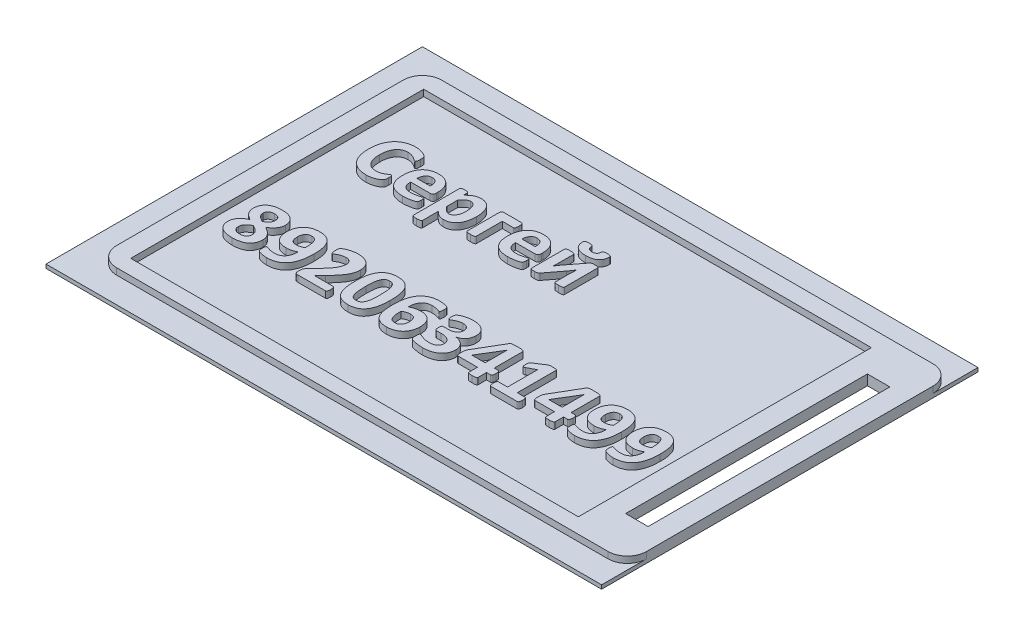
from build123d import *

# Parameters (mm, degrees)
SKETCH_1_W          = 86.5
SKETCH_1_H          = 58.6
EXTRUDE_1_DEPTH     = 0.6
SKETCH_2_W          = 82.5
SKETCH_2_H          = 50.6
EXTRUDE_2_DEPTH     = 1
SKETCH_3_W          = 3.502030807
SKETCH_3_H          = 37.646831178
CUT_EXTRUDE_1_DEPTH = 2
SKETCH_4_W          = 69.690413064
SKETCH_4_H          = 45.613951264
CUT_EXTRUDE_2_DEPTH = 1
FILLET_1_R          = 3
FILLET_2_R          = 3
FILLET_3_R          = 3
FILLET_4_R          = 3
EXTRUDE_3_DEPTH     = 1
EXTRUDE_4_DEPTH     = 1


with BuildPart() as part:
    # Эскиз1 → Бобышка-Вытянуть1 (new body)
    with BuildSketch(Plane(origin=(0, 0, 0), x_dir=(1, 0, 0), z_dir=(0, 1, 0))):
        Rectangle(SKETCH_1_W, SKETCH_1_H)
    extrude(amount=EXTRUDE_1_DEPTH)

    # Эскиз2 → Бобышка-Вытянуть2 (add)
    with BuildSketch(Plane(origin=(0, 0.6, 0), x_dir=(1, 0, 0), z_dir=(0, 1, 0))):
        with Locations((2, 0)):
            Rectangle(SKETCH_2_W, SKETCH_2_H)
    extrude(amount=EXTRUDE_2_DEPTH)

    # Эскиз3 → Вырез-Вытянуть1 (cut)
    with BuildSketch(Plane(origin=(0, 1.6, 0), x_dir=(1, 0, 0), z_dir=(0, 1, 0))):
        with Locations((38.25968657, 0)):
            Rectangle(SKETCH_3_W, SKETCH_3_H)
    extrude(amount=-CUT_EXTRUDE_1_DEPTH, mode=Mode.SUBTRACT)

    # Эскиз4 → Вырез-Вытянуть2 (cut)
    with BuildSketch(Plane(origin=(0, 1.6, 0), x_dir=(1, 0, 0), z_dir=(0, 1, 0))):
        with Locations((-1.575913863, -0.131326155)):
            Rectangle(SKETCH_4_W, SKETCH_4_H)
    extrude(amount=-CUT_EXTRUDE_2_DEPTH, mode=Mode.SUBTRACT)

    # Скругление1
    fillet_1_edges = [part.edges().sort_by_distance(p)[0] for p in [
        (43.25, 1.1, -25.3),
    ]]
    fillet(fillet_1_edges, radius=FILLET_1_R)

    # Скругление2
    fillet_2_edges = [part.edges().sort_by_distance(p)[0] for p in [
        (-39.25, 1.1, -25.3),
    ]]
    fillet(fillet_2_edges, radius=FILLET_2_R)

    # Скругление3
    fillet_3_edges = [part.edges().sort_by_distance(p)[0] for p in [
        (-39.25, 1.1, 25.3),
    ]]
    fillet(fillet_3_edges, radius=FILLET_3_R)

    # Скругление4
    fillet_4_edges = [part.edges().sort_by_distance(p)[0] for p in [
        (43.25, 1.1, 25.3),
    ]]
    fillet(fillet_4_edges, radius=FILLET_4_R)

    # Эскиз5 → Бобышка-Вытянуть3 (add)
    # profile 1 of 11: a face of its own
    with BuildSketch(Plane(origin=(0, 0.6, 0), x_dir=(1, 0, 0), z_dir=(0, 1, 0))):
        with BuildLine():
            add(Edge.make_bspline(
                [(-28.631899851, -10.158441851), (-28.633409461, -10.239731639), (-28.636358516, -10.398532928), (-28.672631534, -10.629782352), (-28.725338051, -10.848369087), (-28.803157794, -11.052460476), (-28.900115372, -11.242417433), (-29.018311074, -11.417996796), (-29.159289178, -11.576708434), (-29.319886652, -11.720829738), (-29.502147814, -11.846314198), (-29.702665455, -11.958575515), (-29.925439142, -12.051005107), (-30.167307327, -12.129172019), (-30.429085892, -12.190921361), (-30.710550707, -12.231324113), (-31.010524237, -12.260305629), (-31.217023745, -12.262854573), (-31.323208445, -12.264165273)],
                knots=[0, 0, 0, 0, 1.005214737, 1.963707865, 2.890356951, 3.783890021, 4.660255313, 5.525147691, 6.395951212, 7.281332096, 8.189267761, 9.129287878, 10.120667592, 11.168998658, 12.272907703, 13.444977467, 14.686174592, 16, 16, 16, 16], degree=3))
            add(Edge.make_bspline(
                [(-31.323208445, -12.264165273), (-31.424810999, -12.262299375), (-31.622020154, -12.258677694), (-31.90871667, -12.237414), (-32.176005961, -12.198376217), (-32.423705222, -12.144491933), (-32.6516798, -12.074859784), (-32.85998662, -11.989467719), (-33.050655044, -11.891087771), (-33.221307885, -11.776798969), (-33.373245398, -11.648705502), (-33.503040893, -11.504084325), (-33.614868821, -11.346925481), (-33.705460727, -11.175125939), (-33.776064209, -10.98936955), (-33.823683015, -10.790159207), (-33.85616669, -10.57825642), (-33.8595621, -10.432639381), (-33.861311616, -10.3576089)],
                knots=[0, 0, 0, 0, 1.352360865, 2.624913755, 3.823255849, 4.944666428, 5.995744585, 6.991482529, 7.937311172, 8.846364595, 9.719576528, 10.575071332, 11.425785957, 12.280513724, 13.152941511, 14.063280215, 15.002087828, 16, 16, 16, 16], degree=3))
            add(Edge.make_bspline(
                [(-33.861311616, -10.3576089), (-33.860682811, -10.305900698), (-33.859441532, -10.203827184), (-33.838999859, -10.053777887), (-33.811041219, -9.908340057), (-33.769407125, -9.76781913), (-33.717360686, -9.631873017), (-33.651477614, -9.501287771), (-33.574911319, -9.375692048), (-33.456855653, -9.211089067), (-33.276906093, -9.015824796), (-33.01817038, -8.802259939), (-32.718626517, -8.598619118), (-32.498371443, -8.479176047), (-32.383730427, -8.417006878)],
                knots=[0, 0, 0, 0, 0.720459814, 1.422208907, 2.108120419, 2.784193939, 3.463086274, 4.135445077, 4.820762983, 5.51249203, 6.957620505, 8.507729903, 10.182301167, 12, 12, 12, 12], degree=3))
            add(Edge.make_bspline(
                [(-32.383730427, -8.417006878), (-32.476428323, -8.362675169), (-32.656888174, -8.256904784), (-32.908017433, -8.080933994), (-33.124907439, -7.885458237), (-33.312890424, -7.676409712), (-33.459635994, -7.442818651), (-33.566640239, -7.187929015), (-33.630823598, -6.90963711), (-33.639144993, -6.716766493), (-33.643419459, -6.617694301)],
                knots=[0, 0, 0, 0, 1.111605955, 2.164021558, 3.165983824, 4.126996401, 5.063613954, 6.005699085, 6.975583916, 8, 8, 8, 8], degree=3))
            add(Edge.make_bspline(
                [(-33.643419459, -6.617694301), (-33.641373783, -6.545540666), (-33.637362129, -6.404044408), (-33.608307222, -6.196779953), (-33.558499048, -6.000161131), (-33.490652841, -5.813003794), (-33.401518785, -5.637385855), (-33.294261848, -5.472953347), (-33.166631689, -5.322300214), (-33.021354915, -5.183129632), (-32.854657717, -5.058774194), (-32.669096385, -4.947802268), (-32.463079969, -4.854589137), (-32.238602874, -4.776311328), (-31.995120625, -4.713004119), (-31.732385107, -4.670348134), (-31.451508123, -4.641833193), (-31.25803071, -4.639265937), (-31.158087045, -4.637939782)],
                knots=[0, 0, 0, 0, 0.963864709, 1.890178498, 2.789289955, 3.669505997, 4.544220225, 5.414719257, 6.286372906, 7.176490452, 8.096828764, 9.058932879, 10.059657577, 11.112220212, 12.232007914, 13.416008536, 14.665200373, 16, 16, 16, 16], degree=3))
            add(Edge.make_bspline(
                [(-31.158087045, -4.637939782), (-31.059871983, -4.639603305), (-30.870513178, -4.642810579), (-30.597438467, -4.666379068), (-30.346157084, -4.70616529), (-30.117117749, -4.764816075), (-29.907400709, -4.835487155), (-29.718662498, -4.922746369), (-29.547243324, -5.02112939), (-29.39806603, -5.136298336), (-29.26423472, -5.260714485), (-29.152711959, -5.400212684), (-29.054497241, -5.548608149), (-28.982020379, -5.711983218), (-28.920572466, -5.882145517), (-28.881145613, -6.063057), (-28.854299256, -6.252030444), (-28.851312314, -6.381545148), (-28.849792008, -6.447466054)],
                knots=[0, 0, 0, 0, 1.414334715, 2.726839733, 3.944018885, 5.073757196, 6.128158228, 7.1264059, 8.064043944, 8.967883359, 9.834955856, 10.688795752, 11.534304537, 12.389863366, 13.255664127, 14.135846165, 15.051175604, 16, 16, 16, 16], degree=3))
            add(Edge.make_bspline(
                [(-28.849792008, -6.447466054), (-28.853965066, -6.535861201), (-28.862322207, -6.712885017), (-28.93296685, -6.971484098), (-29.038874083, -7.220168648), (-29.183295049, -7.455554803), (-29.363638092, -7.678522898), (-29.579941355, -7.885991586), (-29.829532307, -8.080196717), (-30.014556211, -8.190294147), (-30.10948104, -8.246778631)],
                knots=[0, 0, 0, 0, 0.920117842, 1.842666447, 2.775531395, 3.731205609, 4.711408899, 5.757260842, 6.849383112, 8, 8, 8, 8], degree=3))
            add(Edge.make_bspline(
                [(-30.10948104, -8.246778631), (-29.998308541, -8.307356371), (-29.783438027, -8.424439015), (-29.489367978, -8.624263697), (-29.233030662, -8.836257219), (-29.019295616, -9.065354228), (-28.849083646, -9.311348151), (-28.745774384, -9.531476264), (-28.68508709, -9.714393659), (-28.655489668, -9.857843115), (-28.635995315, -10.006406158), (-28.633277218, -10.107309948), (-28.631899851, -10.158441851)],
                knots=[0, 0, 0, 0, 1.488401617, 2.876733215, 4.174748825, 5.393220372, 6.550207752, 7.678741545, 8.240149572, 8.813490423, 9.39874912, 10, 10, 10, 10], degree=3))
        make_face()
        with BuildLine():
            add(Edge.make_bspline(
                [(-30.266091028, -6.58194637), (-30.268865389, -6.518657989), (-30.274189725, -6.397199938), (-30.319471031, -6.225226246), (-30.393595068, -6.0724537), (-30.507358109, -5.947754805), (-30.649432688, -5.846425288), (-30.824928675, -5.778527687), (-31.029189698, -5.732492789), (-31.176509501, -5.72917232), (-31.255117146, -5.727400567)],
                knots=[0, 0, 0, 0, 1.01803902, 1.953739888, 2.844979788, 3.725607907, 4.643773676, 5.63177738, 6.736351818, 8, 8, 8, 8], degree=3))
            add(Edge.make_bspline(
                [(-31.255117146, -5.727400567), (-31.331893961, -5.729736795), (-31.476477225, -5.734136294), (-31.678745107, -5.773587759), (-31.849444846, -5.843927921), (-31.990381359, -5.940425615), (-32.097068245, -6.06403947), (-32.174939874, -6.208367895), (-32.218628065, -6.374611896), (-32.224218302, -6.492043611), (-32.227120439, -6.553007567)],
                knots=[0, 0, 0, 0, 1.268768947, 2.389298845, 3.385938912, 4.302097553, 5.18643146, 6.059496316, 6.992599378, 8, 8, 8, 8], degree=3))
            add(Edge.make_bspline(
                [(-32.227120439, -6.553007567), (-32.224339017, -6.611768124), (-32.218900729, -6.726657825), (-32.171021823, -6.892584737), (-32.090188954, -7.046196076), (-31.974460842, -7.189589137), (-31.822175015, -7.32464034), (-31.634241674, -7.45699162), (-31.408038321, -7.590802144), (-31.244078717, -7.679918503), (-31.156384762, -7.727582476)],
                knots=[0, 0, 0, 0, 0.837252004, 1.637010235, 2.441102344, 3.299813436, 4.251434797, 5.336812646, 6.575591634, 8, 8, 8, 8], degree=3))
            add(Edge.make_bspline(
                [(-31.156384762, -7.727582476), (-31.088702685, -7.687269167), (-30.958189627, -7.609531995), (-30.781281266, -7.479316835), (-30.62613513, -7.347394153), (-30.49771733, -7.208611303), (-30.391770129, -7.065633557), (-30.320360107, -6.910777128), (-30.272858075, -6.749316422), (-30.268352817, -6.63788744), (-30.266091028, -6.58194637)],
                knots=[0, 0, 0, 0, 1.240896861, 2.392852753, 3.457941612, 4.44516871, 5.368342757, 6.248451414, 7.120664105, 8, 8, 8, 8], degree=3))
        make_face(mode=Mode.SUBTRACT)
        with BuildLine():
            add(Edge.make_bspline(
                [(-30.157144949, -10.269090211), (-30.15992776, -10.20113881), (-30.165328901, -10.069252343), (-30.221848818, -9.880663213), (-30.309428377, -9.704700742), (-30.442835953, -9.546268939), (-30.608446819, -9.392710151), (-30.814087012, -9.249074039), (-31.051458684, -9.101000485), (-31.226012561, -9.010948236), (-31.318101597, -8.963439553)],
                knots=[0, 0, 0, 0, 0.878711838, 1.705486542, 2.531475027, 3.41058728, 4.373836987, 5.454189901, 6.656912115, 8, 8, 8, 8], degree=3))
            add(Edge.make_bspline(
                [(-31.318101597, -8.963439553), (-31.398136384, -9.01013406), (-31.550781701, -9.09919156), (-31.759914574, -9.241762838), (-31.938523047, -9.388688663), (-32.084756292, -9.543254013), (-32.198262662, -9.707199587), (-32.278032261, -9.88107329), (-32.32818476, -10.065987895), (-32.333410215, -10.193869378), (-32.336066518, -10.258876517)],
                knots=[0, 0, 0, 0, 1.280230351, 2.441702876, 3.493875971, 4.470304633, 5.372911365, 6.23602954, 7.103305118, 8, 8, 8, 8], degree=3))
            add(Edge.make_bspline(
                [(-32.336066518, -10.258876517), (-32.333310874, -10.329043438), (-32.328046217, -10.463097349), (-32.27421461, -10.651049037), (-32.185512846, -10.812615018), (-32.061519997, -10.947871428), (-31.900166316, -11.050319597), (-31.70625249, -11.123533755), (-31.478868026, -11.166900487), (-31.316033398, -11.17199811), (-31.229582909, -11.174704488)],
                knots=[0, 0, 0, 0, 1.026914924, 1.96192107, 2.837256448, 3.708826073, 4.62282237, 5.613389009, 6.732924999, 8, 8, 8, 8], degree=3))
            add(Edge.make_bspline(
                [(-31.229582909, -11.174704488), (-31.145376517, -11.172034659), (-30.986992771, -11.167012979), (-30.765279802, -11.123108261), (-30.575509589, -11.049872732), (-30.421189033, -10.941232767), (-30.301499969, -10.806213807), (-30.21635893, -10.647080707), (-30.166044687, -10.465013161), (-30.16020148, -10.33637811), (-30.157144949, -10.269090211)],
                knots=[0, 0, 0, 0, 1.26464001, 2.378660545, 3.38122098, 4.299358904, 5.187574635, 6.069090169, 6.989957532, 8, 8, 8, 8], degree=3))
        make_face(mode=Mode.SUBTRACT)
    # profile 2 of 11: a face of its own
    with BuildSketch(Plane(origin=(0, 0.6, 0), x_dir=(1, 0, 0), z_dir=(0, 1, 0))):
        with BuildLine():
            add(Edge.make_bspline(
                [(-22.748811616, -8.11570288), (-22.751422591, -8.268391885), (-22.756737956, -8.579232741), (-22.790405036, -9.04888663), (-22.851775737, -9.522837022), (-22.941094887, -9.911767307), (-23.034790082, -10.215365207), (-23.115259384, -10.438384438), (-23.212371098, -10.654246588), (-23.315793714, -10.866039208), (-23.436622259, -11.066801381), (-23.5736055, -11.255580328), (-23.727173234, -11.430714039), (-23.896105124, -11.594143511), (-24.084655563, -11.740880006), (-24.291737018, -11.872147968), (-24.517556598, -11.988657238), (-24.763744163, -12.087053019), (-25.030332344, -12.168361284), (-25.320275803, -12.223012171), (-25.632208177, -12.257552153), (-25.848003376, -12.261914867), (-25.959316365, -12.264165273)],
                knots=[0, 0, 0, 0, 1.530452467, 3.115660856, 4.717120825, 6.316155104, 7.107717915, 7.901219459, 8.690633922, 9.479125872, 10.262369726, 11.035951869, 11.813891433, 12.594259698, 13.388392856, 14.204106484, 15.048617214, 15.931552947, 16.858194854, 17.837533564, 18.88454144, 20, 20, 20, 20], degree=3))
            add(Edge.make_bspline(
                [(-25.959316365, -12.264165273), (-26.040533847, -12.26265644), (-26.203425698, -12.259630286), (-26.442802285, -12.23147006), (-26.670088599, -12.190051704), (-26.878160232, -12.144700256), (-27.059712385, -12.088961246), (-27.213917368, -12.036135049), (-27.333846825, -11.977591792), (-27.425596752, -11.914672702), (-27.48456009, -11.828862), (-27.522169361, -11.717773261), (-27.539441967, -11.570157006), (-27.541354711, -11.459011098), (-27.542439067, -11.39600121)],
                knots=[0, 0, 0, 0, 1.415567452, 2.839098147, 4.19559782, 5.443570995, 6.548449895, 7.506082698, 8.280334572, 8.873916226, 9.420186956, 10.061709937, 10.901161162, 12, 12, 12, 12], degree=3))
            add(Edge.make_bspline(
                [(-27.542439067, -11.39600121), (-27.542407925, -11.337545064), (-27.542352869, -11.234198301), (-27.535555105, -11.096145683), (-27.525571946, -10.990403283), (-27.5065568, -10.910720427), (-27.477988048, -10.855765504), (-27.442444393, -10.819503962), (-27.398212424, -10.804698342), (-27.367737207, -10.802864594), (-27.35178343, -10.801904626)],
                knots=[0, 0, 0, 0, 2.032661161, 3.59361613, 4.805268322, 5.724313949, 6.422003636, 6.938482535, 7.444295529, 8, 8, 8, 8], degree=3))
            add(Edge.make_bspline(
                [(-27.35178343, -10.801904626), (-27.32494772, -10.804475062), (-27.260457584, -10.810652194), (-27.152991391, -10.846638636), (-27.016948268, -10.887181348), (-26.855564103, -10.939240714), (-26.667650333, -10.984467597), (-26.456436725, -11.031607852), (-26.218816046, -11.06020603), (-26.051884503, -11.063849479), (-25.964423212, -11.06575841)],
                knots=[0, 0, 0, 0, 0.454886135, 1.093157942, 1.906996258, 2.860593712, 3.959632549, 5.175984069, 6.52039899, 8, 8, 8, 8], degree=3))
            add(Edge.make_bspline(
                [(-25.964423212, -11.06575841), (-25.888844346, -11.063957543), (-25.743258185, -11.060488566), (-25.534187908, -11.029608498), (-25.343097988, -10.97884688), (-25.169552507, -10.907247991), (-25.014393459, -10.815546278), (-24.873610797, -10.712104147), (-24.749405502, -10.59263575), (-24.640393725, -10.459074923), (-24.545039402, -10.312935428), (-24.465654866, -10.154595698), (-24.395862599, -9.987481203), (-24.345227954, -9.807994222), (-24.302578514, -9.621065835), (-24.269705026, -9.426200541), (-24.250218677, -9.224216396), (-24.243437879, -9.08717118), (-24.240011064, -9.017912592)],
                knots=[0, 0, 0, 0, 1.196452134, 2.304703457, 3.338022325, 4.321033733, 5.26741902, 6.185870945, 7.082070246, 7.988796301, 8.911065345, 9.839487427, 10.790724476, 11.774598157, 12.788348706, 13.826968678, 14.901814414, 16, 16, 16, 16], degree=3))
            add(Edge.make_bspline(
                [(-24.240011064, -9.017912592), (-24.285677308, -9.045104588), (-24.379975283, -9.101254381), (-24.530995126, -9.177415047), (-24.696122624, -9.247161405), (-24.873164292, -9.312390922), (-25.065446511, -9.365297178), (-25.270800167, -9.404617407), (-25.49073442, -9.426125427), (-25.641512999, -9.429715327), (-25.719294536, -9.431567233)],
                knots=[0, 0, 0, 0, 0.819177999, 1.691551994, 2.604680621, 3.581455082, 4.597998137, 5.675384002, 6.800809734, 8, 8, 8, 8], degree=3))
            add(Edge.make_bspline(
                [(-25.719294536, -9.431567233), (-25.813567281, -9.429658594), (-25.994643583, -9.425992535), (-26.255470492, -9.396719953), (-26.494282863, -9.349724696), (-26.712746853, -9.284760303), (-26.908002018, -9.195305884), (-27.087261252, -9.094936828), (-27.244125453, -8.972060369), (-27.384842758, -8.835260741), (-27.502725688, -8.678717742), (-27.607131862, -8.50921992), (-27.689209912, -8.321698237), (-27.757703954, -8.120823811), (-27.808364959, -7.904602524), (-27.842854837, -7.675129138), (-27.866153913, -7.432429775), (-27.86821863, -7.266321147), (-27.869277302, -7.181149801)],
                knots=[0, 0, 0, 0, 1.26368579, 2.427250315, 3.513406343, 4.524100759, 5.474197979, 6.387616679, 7.271703274, 8.137800737, 9.011217839, 9.891893745, 10.801057316, 11.748928517, 12.734281238, 13.773658334, 14.85845475, 16, 16, 16, 16], degree=3))
            add(Edge.make_bspline(
                [(-27.869277302, -7.181149801), (-27.867335838, -7.090285238), (-27.863526359, -6.911993643), (-27.832979275, -6.650296914), (-27.778993772, -6.400780783), (-27.709063949, -6.16168659), (-27.61501822, -5.9364449), (-27.500317189, -5.726362462), (-27.367572559, -5.530812062), (-27.213210241, -5.352711344), (-27.038312391, -5.191957741), (-26.844125953, -5.048514323), (-26.629032739, -4.925421549), (-26.394700812, -4.821602314), (-26.140346263, -4.736946147), (-25.865314489, -4.68151056), (-25.572227734, -4.643982279), (-25.370453898, -4.639994524), (-25.266487397, -4.637939782)],
                knots=[0, 0, 0, 0, 1.058739241, 2.077424914, 3.064368277, 4.030875631, 4.976459198, 5.902630337, 6.81601363, 7.72546301, 8.642668007, 9.579027735, 10.532898379, 11.524548813, 12.561716757, 13.649805084, 14.789032581, 16, 16, 16, 16], degree=3))
            add(Edge.make_bspline(
                [(-25.266487397, -4.637939782), (-25.183021139, -4.639015388), (-25.021446085, -4.641097559), (-24.787045403, -4.663678592), (-24.568841608, -4.700180779), (-24.366290231, -4.753493376), (-24.178666623, -4.820175031), (-24.004071054, -4.897631621), (-23.8440592, -4.990644654), (-23.698202535, -5.096945571), (-23.561618347, -5.212152254), (-23.441746098, -5.343503947), (-23.329035354, -5.48304061), (-23.23205879, -5.636904967), (-23.142542902, -5.799130844), (-23.064780974, -5.97128194), (-22.996455118, -6.152069314), (-22.918958264, -6.408141569), (-22.84272794, -6.749468237), (-22.788814382, -7.183324855), (-22.753493579, -7.641872389), (-22.750393439, -7.955617046), (-22.748811616, -8.11570288)],
                knots=[0, 0, 0, 0, 1.014424697, 1.96373635, 2.859665263, 3.701285511, 4.506378885, 5.278248456, 6.020095848, 6.751445251, 7.470491163, 8.187946996, 8.909767116, 9.648368037, 10.395456877, 11.161043306, 11.942593023, 12.743419402, 14.411965646, 16.186598095, 18.054240574, 20, 20, 20, 20], degree=3))
        make_face()
        with BuildLine():
            add(Edge.make_bspline(
                [(-24.274056714, -7.882490181), (-24.274313759, -7.788840674), (-24.274807907, -7.608807046), (-24.28946788, -7.351104944), (-24.308702851, -7.116983328), (-24.33737269, -6.906669071), (-24.374555593, -6.717807068), (-24.420121882, -6.550032699), (-24.472026697, -6.400967494), (-24.535501201, -6.273090091), (-24.605718834, -6.161395492), (-24.685300674, -6.067780551), (-24.773458068, -5.99099866), (-24.870383236, -5.932035266), (-24.976379676, -5.89058597), (-25.088164175, -5.856741013), (-25.209878988, -5.84097739), (-25.293127373, -5.83792758), (-25.336280979, -5.836346645)],
                knots=[0, 0, 0, 0, 1.724037892, 3.314323882, 4.751173022, 6.048486653, 7.220520937, 8.292645254, 9.247761345, 10.121524596, 10.915637301, 11.671508539, 12.375253584, 13.05973367, 13.748506206, 14.466075588, 15.204857005, 16, 16, 16, 16], degree=3))
            add(Edge.make_bspline(
                [(-25.336280979, -5.836346645), (-25.378335515, -5.837102182), (-25.459418337, -5.838558888), (-25.577043579, -5.85614554), (-25.685553864, -5.884698802), (-25.81687792, -5.936351617), (-25.962821963, -6.028699055), (-26.104940244, -6.17968893), (-26.214425991, -6.363061176), (-26.289665746, -6.57552883), (-26.336222346, -6.812577573), (-26.341360789, -6.978916814), (-26.344032204, -7.065394593)],
                knots=[0, 0, 0, 0, 0.700350648, 1.350303964, 1.976502457, 2.566526108, 3.697232059, 4.820917017, 5.991835401, 7.230375072, 8.56010518, 10, 10, 10, 10], degree=3))
            add(Edge.make_bspline(
                [(-26.344032204, -7.065394593), (-26.34148388, -7.156305744), (-26.336663004, -7.328289941), (-26.299612101, -7.569654014), (-26.232353414, -7.776014012), (-26.1356208, -7.948653389), (-25.998079146, -8.079268868), (-25.858370545, -8.155503516), (-25.731330938, -8.194368444), (-25.624778328, -8.216541643), (-25.509120743, -8.230065385), (-25.428808589, -8.23210663), (-25.387349453, -8.233160371)],
                knots=[0, 0, 0, 0, 1.565833155, 2.962216993, 4.189303543, 5.288982354, 6.332815194, 7.413212199, 7.997463676, 8.616645061, 9.285877698, 10, 10, 10, 10], degree=3))
            add(Edge.make_bspline(
                [(-25.387349453, -8.233160371), (-25.334550448, -8.231530724), (-25.229824906, -8.228298359), (-25.075201076, -8.212321245), (-24.925918739, -8.180226796), (-24.734997507, -8.126920606), (-24.511232819, -8.035833104), (-24.351565334, -7.932602305), (-24.274056714, -7.882490181)],
                knots=[0, 0, 0, 0, 0.802046375, 1.590839501, 2.356323732, 3.117333683, 4.600645023, 6, 6, 6, 6], degree=3))
        make_face(mode=Mode.SUBTRACT)
    # profile 3 of 11: a face of its own
    with BuildSketch(Plane(origin=(0, 0.6, 0), x_dir=(1, 0, 0), z_dir=(0, 1, 0))):
        with BuildLine():
            add(Edge.make_bspline(
                [(-16.647831224, -11.552611198), (-16.648086009, -11.603164992), (-16.648556379, -11.696494649), (-16.661643523, -11.824742278), (-16.67618054, -11.93153097), (-16.702110705, -12.016052987), (-16.732322012, -12.082786857), (-16.777376617, -12.12650092), (-16.829709306, -12.149619137), (-16.866087243, -12.153340759), (-16.884448488, -12.155219194)],
                knots=[0, 0, 0, 0, 1.700477232, 3.139328327, 4.338937117, 5.31779253, 6.112293145, 6.774269824, 7.381330181, 8, 8, 8, 8], degree=3))
            Line((-16.884448488, -12.155219194), (-21.179307173, -12.155219194))
            add(Edge.make_bspline(
                [(-21.179307173, -12.155219194), (-21.219064772, -12.154391748), (-21.293338692, -12.152845938), (-21.397090378, -12.13781182), (-21.484988096, -12.103806349), (-21.556436765, -12.046087042), (-21.606428342, -11.959878491), (-21.63949319, -11.846466205), (-21.655768567, -11.701170071), (-21.658074299, -11.593497406), (-21.659350831, -11.533886091)],
                knots=[0, 0, 0, 0, 1.025949817, 1.916647791, 2.69162005, 3.43032923, 4.23901448, 5.220859075, 6.461371377, 8, 8, 8, 8], degree=3))
            add(Edge.make_bspline(
                [(-21.659350831, -11.533886091), (-21.658153144, -11.475997844), (-21.655942741, -11.369161614), (-21.645630378, -11.219753747), (-21.622267849, -11.090890539), (-21.584050546, -10.976025221), (-21.52899273, -10.87217384), (-21.464911699, -10.76771438), (-21.380094782, -10.662826491), (-21.31590073, -10.592709471), (-21.281444122, -10.555073667)],
                knots=[0, 0, 0, 0, 1.279770231, 2.361892714, 3.306414937, 4.167028953, 5.025172171, 5.898575693, 6.872045744, 8, 8, 8, 8], degree=3))
            Line((-21.281444122, -10.555073667), (-20.020052808, -9.200056817))
            add(Edge.make_bspline(
                [(-20.020052808, -9.200056817), (-19.960111776, -9.134559287), (-19.844199122, -9.0079016), (-19.682335826, -8.819367169), (-19.539346039, -8.639265043), (-19.414345538, -8.467983303), (-19.304269541, -8.304951146), (-19.208251157, -8.149630916), (-19.123277564, -8.001910624), (-19.030814285, -7.819291575), (-18.941452191, -7.604443029), (-18.87138085, -7.357871653), (-18.834666297, -7.128968489), (-18.829325874, -6.981526345), (-18.826752792, -6.910486887)],
                knots=[0, 0, 0, 0, 1.20947157, 2.338849612, 3.384319872, 4.341377303, 5.226828348, 6.063423144, 6.828539773, 7.547598628, 8.851019864, 9.991402106, 11.032232556, 12, 12, 12, 12], degree=3))
            add(Edge.make_bspline(
                [(-18.826752792, -6.910486887), (-18.829768176, -6.853451909), (-18.835741566, -6.740467235), (-18.881127736, -6.577967127), (-18.954257414, -6.428421963), (-19.060360666, -6.299706819), (-19.193843772, -6.190804646), (-19.35965436, -6.113236174), (-19.554650583, -6.062336696), (-19.695122055, -6.05704999), (-19.769817284, -6.054238802)],
                knots=[0, 0, 0, 0, 0.952592796, 1.887059298, 2.799298945, 3.716508085, 4.654435942, 5.655858967, 6.753510967, 8, 8, 8, 8], degree=3))
            add(Edge.make_bspline(
                [(-19.769817284, -6.054238802), (-19.824321014, -6.055200803), (-19.930151785, -6.057068735), (-20.084556496, -6.072059439), (-20.228900113, -6.099633855), (-20.404693204, -6.146486498), (-20.602417474, -6.219679774), (-20.812776623, -6.318164875), (-20.990567837, -6.417608694), (-21.11871723, -6.494921283), (-21.203998055, -6.551084608), (-21.259622404, -6.575677794), (-21.306784404, -6.595565125), (-21.337471972, -6.597915065), (-21.351237703, -6.598969194)],
                knots=[0, 0, 0, 0, 1.155956231, 2.244538859, 3.28550842, 4.269318886, 6.100628768, 7.748195433, 9.191883973, 10.417953324, 10.925724687, 11.351067817, 11.708904068, 12, 12, 12, 12], degree=3))
            add(Edge.make_bspline(
                [(-21.351237703, -6.598969194), (-21.367566504, -6.597508652), (-21.400454594, -6.594566952), (-21.444509417, -6.563042518), (-21.478972391, -6.512189957), (-21.503238371, -6.438078401), (-21.522354892, -6.339737855), (-21.539477722, -6.213599767), (-21.548796492, -6.057780038), (-21.549837772, -5.944169595), (-21.550404753, -5.882308272)],
                knots=[0, 0, 0, 0, 0.485692822, 0.97824142, 1.565816375, 2.311318477, 3.305989244, 4.581102635, 6.138397226, 8, 8, 8, 8], degree=3))
            add(Edge.make_bspline(
                [(-21.550404753, -5.882308272), (-21.550381141, -5.840299877), (-21.550338344, -5.76415813), (-21.54286755, -5.659123335), (-21.533634678, -5.571365738), (-21.518321773, -5.496617521), (-21.49779616, -5.432689602), (-21.470912211, -5.373225044), (-21.427765815, -5.313932359), (-21.378945999, -5.260367446), (-21.322239903, -5.212862998), (-21.262822115, -5.171167146), (-21.188760864, -5.124470795), (-21.06262286, -5.056904796), (-20.876065405, -4.966169451), (-20.616755294, -4.868082984), (-20.321931381, -4.777271979), (-19.997916163, -4.700301335), (-19.651222801, -4.647111732), (-19.412536683, -4.641026295), (-19.291475908, -4.637939782)],
                knots=[0, 0, 0, 0, 0.788292368, 1.428808632, 1.975788089, 2.443732868, 2.858052408, 3.234493626, 3.66294862, 4.228288178, 4.591069522, 5.049213324, 5.590039132, 6.233559628, 7.734267659, 9.480939635, 11.431700141, 13.521863135, 15.728704436, 18, 18, 18, 18], degree=3))
            add(Edge.make_bspline(
                [(-19.291475908, -4.637939782), (-19.197208671, -4.639316802), (-19.014493221, -4.641985839), (-18.749279195, -4.669874636), (-18.502346495, -4.714419998), (-18.274364242, -4.780139802), (-18.064775395, -4.859830223), (-17.872454924, -4.953091687), (-17.699705747, -5.062519976), (-17.545169052, -5.186022546), (-17.409041844, -5.321717708), (-17.290913234, -5.470587715), (-17.192915174, -5.632213025), (-17.112194739, -5.805122657), (-17.051643904, -5.987691779), (-17.007683879, -6.17687852), (-16.978827906, -6.372817519), (-16.976071252, -6.505807753), (-16.974669459, -6.573434957)],
                knots=[0, 0, 0, 0, 1.324900052, 2.568015312, 3.744666331, 4.8481595, 5.898614886, 6.894039723, 7.847934722, 8.767415271, 9.669989851, 10.544631889, 11.43259769, 12.321315746, 13.221949113, 14.131442766, 15.049815173, 16, 16, 16, 16], degree=3))
            add(Edge.make_bspline(
                [(-16.974669459, -6.573434957), (-16.978001396, -6.693328569), (-16.984648163, -6.932500247), (-17.028124092, -7.230438108), (-17.083016129, -7.469570136), (-17.146681835, -7.65421344), (-17.224076351, -7.847341202), (-17.324634452, -8.046461452), (-17.442871009, -8.25580683), (-17.582810389, -8.475009977), (-17.74500871, -8.704800534), (-17.930741004, -8.946203525), (-18.141994075, -9.203800334), (-18.38385503, -9.479134251), (-18.658615255, -9.773200567), (-18.854170834, -9.973832516), (-18.95612626, -10.078434574)],
                knots=[0, 0, 0, 0, 1.214695824, 2.423155294, 3.043825433, 3.698462194, 4.400034292, 5.150962269, 5.956941602, 6.835925221, 7.785176393, 8.806499493, 9.921972916, 11.160753287, 12.51972206, 14, 14, 14, 14], degree=3))
            Line((-18.95612626, -10.078434574), (-19.807267498, -10.956812332))
            Line((-19.807267498, -10.956812332), (-16.903173595, -10.956812332))
            add(Edge.make_bspline(
                [(-16.903173595, -10.956812332), (-16.884663407, -10.958382043), (-16.847493647, -10.961534135), (-16.795971154, -10.990476195), (-16.748689724, -11.033552477), (-16.711751208, -11.098579688), (-16.680673595, -11.181565812), (-16.662862947, -11.287064812), (-16.648276369, -11.412612241), (-16.647986584, -11.503750118), (-16.647831224, -11.552611198)],
                knots=[0, 0, 0, 0, 0.620001289, 1.24500623, 1.94939785, 2.757032326, 3.738367869, 4.928457297, 6.353276405, 8, 8, 8, 8], degree=3))
        make_face()
    # profile 4 of 11: a face of its own
    with BuildSketch(Plane(origin=(0, 0.6, 0), x_dir=(1, 0, 0), z_dir=(0, 1, 0))):
        with BuildLine():
            add(Edge.make_bspline(
                [(-10.546850831, -8.422113726), (-10.548281743, -8.565716448), (-10.551072788, -8.845818827), (-10.578678395, -9.255484181), (-10.624542754, -9.64347124), (-10.686269462, -10.009953883), (-10.768241929, -10.353318548), (-10.875762459, -10.671109136), (-11.00473202, -10.963372211), (-11.155794682, -11.229508288), (-11.33289661, -11.466345813), (-11.532365741, -11.676661211), (-11.759826691, -11.854357585), (-12.010814894, -12.004493718), (-12.288902534, -12.122613542), (-12.59631485, -12.205879055), (-12.932450319, -12.254707816), (-13.166497364, -12.260941676), (-13.287525617, -12.264165273)],
                knots=[0, 0, 0, 0, 1.280142505, 2.496964928, 3.658445283, 4.762089533, 5.808699902, 6.802158264, 7.748814871, 8.653008089, 9.524146816, 10.379274413, 11.229404425, 12.089188086, 12.979964829, 13.913938538, 14.921275101, 16, 16, 16, 16], degree=3))
            add(Edge.make_bspline(
                [(-13.287525617, -12.264165273), (-13.410242703, -12.260869053), (-13.64532436, -12.254554685), (-13.982060341, -12.207673623), (-14.285302758, -12.126554233), (-14.556820146, -12.013237417), (-14.798784502, -11.869262087), (-15.010324254, -11.692530818), (-15.201343068, -11.492678048), (-15.360645954, -11.25943367), (-15.497423397, -11.000383624), (-15.610193209, -10.714400432), (-15.705211843, -10.402859593), (-15.772358402, -10.063769217), (-15.822136303, -9.700321139), (-15.859598735, -9.314187165), (-15.881918558, -8.90469375), (-15.884091923, -8.6241464), (-15.885208675, -8.47999133)],
                knots=[0, 0, 0, 0, 1.116564975, 2.138935591, 3.085931557, 3.965362537, 4.808430945, 5.637530691, 6.466775146, 7.316224023, 8.198621357, 9.127780993, 10.109559384, 11.158728965, 12.269463774, 13.447127443, 14.688244517, 16, 16, 16, 16], degree=3))
            add(Edge.make_bspline(
                [(-15.885208675, -8.47999133), (-15.884062867, -8.336932244), (-15.881827829, -8.057878075), (-15.850232362, -7.649704007), (-15.808711005, -7.261727992), (-15.743777397, -6.894952192), (-15.659976919, -6.550793023), (-15.553727313, -6.231817186), (-15.423522726, -5.940000149), (-15.272287026, -5.674201438), (-15.096416488, -5.435267326), (-14.894497883, -5.226060147), (-14.667234223, -5.047644936), (-14.416106523, -4.897647025), (-14.138062928, -4.779453475), (-13.831704834, -4.696643887), (-13.497378392, -4.647227467), (-13.265004083, -4.641110837), (-13.144533889, -4.637939782)],
                knots=[0, 0, 0, 0, 1.275935792, 2.488868156, 3.650539398, 4.755790181, 5.809222936, 6.808140458, 7.750805295, 8.655602092, 9.531384403, 10.390594486, 11.241291987, 12.101649582, 12.993020947, 13.927618113, 14.925611662, 16, 16, 16, 16], degree=3))
            add(Edge.make_bspline(
                [(-13.144533889, -4.637939782), (-13.021763887, -4.640263874), (-12.785914498, -4.644728609), (-12.449346877, -4.69555691), (-12.143914971, -4.773098444), (-11.872174439, -4.889227091), (-11.629026044, -5.033059821), (-11.413816517, -5.206657256), (-11.226440641, -5.410182587), (-11.066015077, -5.64243336), (-10.929859527, -5.901863459), (-10.815787253, -6.187065723), (-10.726282755, -6.49992956), (-10.657778646, -6.838240703), (-10.607757212, -7.201707972), (-10.573081064, -7.588024093), (-10.549971135, -7.99739693), (-10.547909944, -8.277953775), (-10.546850831, -8.422113726)],
                knots=[0, 0, 0, 0, 1.1154279, 2.142811628, 3.087698179, 3.973172265, 4.819981724, 5.64914424, 6.477969577, 7.326725871, 8.20840376, 9.136805822, 10.114848545, 11.163162705, 12.272991897, 13.449208879, 14.689314032, 16, 16, 16, 16], degree=3))
        make_face()
        with BuildLine():
            add(Edge.make_bspline(
                [(-12.07209593, -8.498716437), (-12.072461701, -8.414169756), (-12.073168768, -8.250734077), (-12.077487625, -8.012888907), (-12.088828574, -7.791091656), (-12.099469156, -7.583225986), (-12.116919187, -7.389725922), (-12.137251624, -7.209236246), (-12.160137446, -7.042041705), (-12.198609292, -6.844158548), (-12.24853794, -6.623462249), (-12.332545116, -6.39453682), (-12.428927328, -6.204705889), (-12.551852032, -6.059863708), (-12.689853902, -5.94962618), (-12.849100273, -5.881917576), (-13.022734879, -5.841585847), (-13.144292412, -5.838139302), (-13.207518341, -5.836346645)],
                knots=[0, 0, 0, 0, 1.252656067, 2.421487074, 3.523945301, 4.542880805, 5.504947389, 6.401770782, 7.23401126, 8.00401156, 9.388497809, 10.580084833, 11.61067594, 12.523473101, 13.374357542, 14.202341007, 15.064980546, 16, 16, 16, 16], degree=3))
            add(Edge.make_bspline(
                [(-13.207518341, -5.836346645), (-13.262178114, -5.838054491), (-13.367323898, -5.841339775), (-13.517275923, -5.873521581), (-13.65436914, -5.921372524), (-13.774746131, -5.99519459), (-13.88315017, -6.086920807), (-13.975939735, -6.201502423), (-14.060376182, -6.333497569), (-14.13121009, -6.486092777), (-14.190022076, -6.658259324), (-14.241185194, -6.849257094), (-14.281454172, -7.060943228), (-14.311194798, -7.292379699), (-14.332918866, -7.543445364), (-14.347396741, -7.814271775), (-14.358296485, -8.104834839), (-14.359396554, -8.305212414), (-14.359963577, -8.408495466)],
                knots=[0, 0, 0, 0, 0.830406459, 1.597403976, 2.323929485, 3.028688112, 3.73286484, 4.474568648, 5.262512747, 6.112128818, 7.026802286, 8.027809387, 9.118195914, 10.302553145, 11.576589742, 12.951469302, 14.428658737, 16, 16, 16, 16], degree=3))
            add(Edge.make_bspline(
                [(-14.359963577, -8.408495466), (-14.359482, -8.533337414), (-14.358562377, -8.771736842), (-14.347032388, -9.112378658), (-14.326259574, -9.419420939), (-14.300795275, -9.694611914), (-14.263052904, -9.939432981), (-14.217744324, -10.156761118), (-14.163719557, -10.348119956), (-14.101871478, -10.514868944), (-14.028177225, -10.656825879), (-13.944554734, -10.775439428), (-13.852012184, -10.873278814), (-13.74787104, -10.948112389), (-13.632355236, -11.001317753), (-13.507689923, -11.037510728), (-13.373116982, -11.063293598), (-13.279713692, -11.064917545), (-13.231350295, -11.06575841)],
                knots=[0, 0, 0, 0, 1.85321902, 3.538925519, 5.058498589, 6.421342315, 7.640056482, 8.733733654, 9.714903156, 10.58939389, 11.369318339, 12.082176755, 12.737469836, 13.359260972, 13.973474606, 14.615698241, 15.283220796, 16, 16, 16, 16], degree=3))
            add(Edge.make_bspline(
                [(-13.231350295, -11.06575841), (-13.160042794, -11.063011789), (-13.02374805, -11.05776199), (-12.831416521, -11.003417906), (-12.663157664, -10.913546189), (-12.520192785, -10.783669035), (-12.398728518, -10.620183376), (-12.302452857, -10.418696384), (-12.224041546, -10.185146878), (-12.161571468, -9.917211362), (-12.116484643, -9.614361271), (-12.089333199, -9.274845343), (-12.074853922, -8.898886353), (-12.073042421, -8.636047354), (-12.07209593, -8.498716437)],
                knots=[0, 0, 0, 0, 0.812198358, 1.552408438, 2.25954763, 2.970620909, 3.738781613, 4.570097942, 5.508197261, 6.546623335, 7.706294858, 8.999891258, 10.432471252, 12, 12, 12, 12], degree=3))
        make_face(mode=Mode.SUBTRACT)
    # profile 5 of 11: a face of its own
    with BuildSketch(Plane(origin=(0, 0.6, 0), x_dir=(1, 0, 0), z_dir=(0, 1, 0))):
        with BuildLine():
            add(Edge.make_bspline(
                [(-4.663762596, -9.661375368), (-4.665575324, -9.752823598), (-4.669156237, -9.933472918), (-4.702010786, -10.199024427), (-4.757065135, -10.454543506), (-4.8315159, -10.699077688), (-4.92518698, -10.931398159), (-5.045430086, -11.145249973), (-5.180151785, -11.345668288), (-5.338701413, -11.527128018), (-5.516028511, -11.691188235), (-5.713692494, -11.83605547), (-5.928780284, -11.965268987), (-6.164655001, -12.071127044), (-6.417938519, -12.160152885), (-6.691279268, -12.219241577), (-6.982832751, -12.25848124), (-7.183569255, -12.26223269), (-7.286979891, -12.264165273)],
                knots=[0, 0, 0, 0, 1.052094964, 2.078336987, 3.073525958, 4.056795553, 5.017248361, 5.94962998, 6.875194829, 7.791754631, 8.716005461, 9.649849497, 10.607389713, 11.598026182, 12.620271304, 13.691227089, 14.810621544, 16, 16, 16, 16], degree=3))
            add(Edge.make_bspline(
                [(-7.286979891, -12.264165273), (-7.370453403, -12.263137114), (-7.532042499, -12.261146791), (-7.766251252, -12.23793203), (-7.984564073, -12.203707193), (-8.186544771, -12.152083394), (-8.373567084, -12.08758516), (-8.546222876, -12.008397831), (-8.707554315, -11.91836964), (-8.855622563, -11.814320816), (-8.991125485, -11.698315468), (-9.111808051, -11.569432782), (-9.222585228, -11.431221251), (-9.317186019, -11.278918276), (-9.399971981, -11.115551846), (-9.47709988, -10.944541861), (-9.543506995, -10.762317064), (-9.621470052, -10.502690357), (-9.694335886, -10.153390977), (-9.751504136, -9.708832938), (-9.777781349, -9.233296252), (-9.782038518, -8.906719766), (-9.784228282, -8.738738266)],
                knots=[0, 0, 0, 0, 1.005033513, 1.945556776, 2.832059393, 3.664177915, 4.453103597, 5.211602499, 5.949119833, 6.675308483, 7.387697722, 8.093532862, 8.799070145, 9.517726285, 10.248275697, 11.003967447, 11.775895392, 12.582387437, 14.267390505, 16.066249085, 17.976592289, 20, 20, 20, 20], degree=3))
            add(Edge.make_bspline(
                [(-9.784228282, -8.738738266), (-9.782112557, -8.591166931), (-9.777778655, -8.288878276), (-9.746507677, -7.829832887), (-9.683813793, -7.364287569), (-9.597624146, -6.980377016), (-9.507208756, -6.679586671), (-9.426134008, -6.459465435), (-9.330931203, -6.24529665), (-9.226935606, -6.035753675), (-9.106645248, -5.835314395), (-8.970098888, -5.646708598), (-8.815568095, -5.472352215), (-8.644984044, -5.310311882), (-8.457556424, -5.160965484), (-8.249727353, -5.030047834), (-8.02442739, -4.913801307), (-7.779550609, -4.815041786), (-7.513608422, -4.733241687), (-7.224045191, -4.679486434), (-6.911637897, -4.644343709), (-6.695825019, -4.640126294), (-6.583937229, -4.637939782)],
                knots=[0, 0, 0, 0, 1.491443386, 3.055108323, 4.647161893, 6.234581436, 7.025567321, 7.820286444, 8.60345859, 9.393383516, 10.183141888, 10.963158189, 11.743258812, 12.534265486, 13.338548608, 14.161046816, 15.012581643, 15.897544149, 16.826403745, 17.819517065, 18.869532616, 20, 20, 20, 20], degree=3))
            add(Edge.make_bspline(
                [(-6.583937229, -4.637939782), (-6.510685773, -4.63921803), (-6.363336806, -4.641789289), (-6.144712603, -4.663556982), (-5.932684045, -4.692958266), (-5.735914294, -4.732553923), (-5.560160371, -4.773500312), (-5.416196407, -4.825220058), (-5.306817048, -4.870200987), (-5.235201188, -4.915904285), (-5.189461246, -4.959097492), (-5.163825028, -5.007428764), (-5.139628531, -5.057270944), (-5.126530165, -5.114980853), (-5.110246466, -5.179588028), (-5.10631028, -5.257598625), (-5.099917741, -5.3505144), (-5.099677855, -5.418127621), (-5.09954691, -5.455035371)],
                knots=[0, 0, 0, 0, 1.790819153, 3.602322331, 5.368404252, 7.022926428, 8.510406466, 9.774233699, 10.761844726, 11.392996174, 11.844328221, 12.279811468, 12.720786524, 13.19540678, 13.720669324, 14.347535504, 15.097976019, 16, 16, 16, 16], degree=3))
            add(Edge.make_bspline(
                [(-5.09954691, -5.455035371), (-5.099621478, -5.511227953), (-5.099757126, -5.613449962), (-5.106555617, -5.751417438), (-5.116218718, -5.860743817), (-5.136113511, -5.942906722), (-5.162906527, -6.003680333), (-5.200928741, -6.044166289), (-5.248044835, -6.068310398), (-5.282542017, -6.07025438), (-5.300416242, -6.071261627)],
                knots=[0, 0, 0, 0, 1.888449276, 3.435348052, 4.644422216, 5.569671885, 6.269206351, 6.849327691, 7.40379549, 8, 8, 8, 8], degree=3))
            add(Edge.make_bspline(
                [(-5.300416242, -6.071261627), (-5.326668552, -6.068633364), (-5.386969574, -6.062596298), (-5.48545117, -6.031436975), (-5.605393931, -5.992193822), (-5.748568217, -5.946502343), (-5.917784931, -5.904427247), (-6.114529116, -5.86618159), (-6.34211627, -5.840191248), (-6.504418604, -5.837681544), (-6.590746358, -5.836346645)],
                knots=[0, 0, 0, 0, 0.479331651, 1.101015033, 1.872171618, 2.780746856, 3.83579878, 5.045610707, 6.428575928, 8, 8, 8, 8], degree=3))
            add(Edge.make_bspline(
                [(-6.590746358, -5.836346645), (-6.665192707, -5.838166189), (-6.809086365, -5.841683096), (-7.015865691, -5.872537473), (-7.205407857, -5.923085374), (-7.376522731, -5.995350274), (-7.531048092, -6.083944697), (-7.668703542, -6.190112186), (-7.793424104, -6.308230643), (-7.901250851, -6.443127695), (-7.994435173, -6.589708422), (-8.075133933, -6.747454688), (-8.141634113, -6.916844078), (-8.193337477, -7.097256963), (-8.234473936, -7.286625254), (-8.262461758, -7.48410949), (-8.281906027, -7.68976722), (-8.285886557, -7.829674312), (-8.287921986, -7.901215288)],
                knots=[0, 0, 0, 0, 1.177742439, 2.276399977, 3.300389835, 4.274485222, 5.207989402, 6.111505077, 7.019828615, 7.920303948, 8.837112545, 9.76494003, 10.720560743, 11.712421005, 12.732346221, 13.785268587, 14.867505249, 16, 16, 16, 16], degree=3))
            add(Edge.make_bspline(
                [(-8.287921986, -7.901215288), (-8.243384619, -7.874037721), (-8.149654123, -7.81684155), (-7.997435019, -7.738154844), (-7.829839071, -7.662059857), (-7.64472167, -7.600092233), (-7.445609697, -7.547654433), (-7.231551797, -7.504834666), (-7.002437864, -7.474047444), (-6.843926167, -7.471727149), (-6.762676888, -7.470537822)],
                knots=[0, 0, 0, 0, 0.779327225, 1.640122279, 2.558603002, 3.526465564, 4.55261428, 5.633346691, 6.786910502, 8, 8, 8, 8], degree=3))
            add(Edge.make_bspline(
                [(-6.762676888, -7.470537822), (-6.672935666, -7.472462332), (-6.499768887, -7.476175912), (-6.250323504, -7.505506432), (-6.020131281, -7.552007928), (-5.809867805, -7.620612444), (-5.618401987, -7.706007587), (-5.443834594, -7.806087376), (-5.290159056, -7.926879531), (-5.15300189, -8.062119148), (-5.032079919, -8.21272003), (-4.932848023, -8.381350672), (-4.846370819, -8.562588929), (-4.779293207, -8.759440414), (-4.726866746, -8.968487551), (-4.689629264, -9.18931617), (-4.667074417, -9.421444792), (-4.664883344, -9.580180874), (-4.663762596, -9.661375368)],
                knots=[0, 0, 0, 0, 1.239751886, 2.392254473, 3.465624754, 4.479769077, 5.441484179, 6.358632481, 7.25263028, 8.134197614, 9.015869549, 9.912785271, 10.831741688, 11.78643114, 12.781018179, 13.807095441, 14.878315683, 16, 16, 16, 16], degree=3))
        make_face()
        with BuildLine():
            add(Edge.make_bspline(
                [(-6.189007694, -9.812878508), (-6.190592464, -9.724731023), (-6.193565911, -9.559342958), (-6.233477172, -9.328081863), (-6.295414306, -9.127947493), (-6.39234749, -8.960674759), (-6.524430437, -8.826664352), (-6.664285274, -8.751309269), (-6.790133582, -8.709135161), (-6.896159688, -8.685156001), (-7.012585854, -8.672089052), (-7.093455542, -8.670019867), (-7.135476751, -8.668944684)],
                knots=[0, 0, 0, 0, 1.544136591, 2.897209858, 4.102556162, 5.200035191, 6.255607157, 7.360461559, 7.948979087, 8.581539878, 9.262944991, 10, 10, 10, 10], degree=3))
            add(Edge.make_bspline(
                [(-7.135476751, -8.668944684), (-7.186617152, -8.670225359), (-7.288737022, -8.672782678), (-7.440121554, -8.694293608), (-7.58921666, -8.72667325), (-7.734358076, -8.770561698), (-7.875312022, -8.825658465), (-8.009432621, -8.890070732), (-8.138025795, -8.959740054), (-8.218974864, -9.011202745), (-8.258983184, -9.036637699)],
                knots=[0, 0, 0, 0, 1.023182102, 2.043144358, 3.054534018, 4.074938816, 5.074654996, 6.080545499, 7.051327576, 8, 8, 8, 8], degree=3))
            add(Edge.make_bspline(
                [(-8.258983184, -9.036637699), (-8.258749495, -9.130855322), (-8.258302951, -9.310890897), (-8.243511929, -9.568589216), (-8.224313066, -9.802136381), (-8.195759683, -10.012485823), (-8.15842542, -10.20001308), (-8.114560472, -10.366977883), (-8.062616367, -10.513891898), (-8.001110205, -10.641276961), (-7.931757832, -10.750380433), (-7.851175226, -10.839483305), (-7.767088375, -10.916480574), (-7.670999834, -10.97336143), (-7.566862062, -11.013350188), (-7.456001424, -11.045127742), (-7.336228799, -11.061052125), (-7.254104766, -11.064165304), (-7.212079462, -11.06575841)],
                knots=[0, 0, 0, 0, 1.750429098, 3.344804261, 4.794861443, 6.104100456, 7.286908508, 8.345779056, 9.309674924, 10.177362526, 10.969917035, 11.701946289, 12.404210742, 13.080507119, 13.761880499, 14.473033236, 15.218605803, 16, 16, 16, 16], degree=3))
            add(Edge.make_bspline(
                [(-7.212079462, -11.06575841), (-7.171130945, -11.065151276), (-7.091040057, -11.063963788), (-6.975443678, -11.043839216), (-6.867013997, -11.015946827), (-6.735700853, -10.960857496), (-6.586587201, -10.866748049), (-6.441642797, -10.710369592), (-6.329629325, -10.522186272), (-6.247957235, -10.306781746), (-6.198415158, -10.067035517), (-6.192209062, -9.89936835), (-6.189007694, -9.812878508)],
                knots=[0, 0, 0, 0, 0.673288761, 1.316880279, 1.92655057, 2.513013161, 3.655971931, 4.799388861, 5.989931897, 7.240969136, 8.576774776, 10, 10, 10, 10], degree=3))
        make_face(mode=Mode.SUBTRACT)
    # profile 6 of 11: a face of its own
    with BuildSketch(Plane(origin=(0, 0.6, 0), x_dir=(1, 0, 0), z_dir=(0, 1, 0))):
        with BuildLine():
            add(Edge.make_bspline(
                [(1.219325639, -9.959274801), (1.216681574, -10.049631445), (1.211533557, -10.22555654), (1.172204379, -10.482393388), (1.103958113, -10.722820842), (1.009906339, -10.947332587), (0.89168885, -11.154517527), (0.751211881, -11.344370492), (0.590063014, -11.517211132), (0.409037772, -11.673351731), (0.206216101, -11.808292855), (-0.012306555, -11.931244413), (-0.252153558, -12.03213497), (-0.508789938, -12.117255459), (-0.781093844, -12.182779341), (-1.066533252, -12.230989189), (-1.364801229, -12.257570109), (-1.567829186, -12.261940953), (-1.671150004, -12.264165273)],
                knots=[0, 0, 0, 0, 1.041492781, 2.0277946, 2.986615217, 3.916084947, 4.827326187, 5.730145009, 6.632774193, 7.546712009, 8.479353451, 9.436923451, 10.433370232, 11.473958583, 12.551323838, 13.6590864, 14.808710327, 16, 16, 16, 16], degree=3))
            add(Edge.make_bspline(
                [(-1.671150004, -12.264165273), (-1.79490111, -12.262155252), (-2.035378915, -12.258249304), (-2.381659871, -12.229806473), (-2.695947359, -12.183115328), (-2.972979768, -12.130522061), (-3.207117743, -12.068885083), (-3.37426109, -12.016438202), (-3.48392592, -11.974762414), (-3.544278669, -11.942557706), (-3.593905891, -11.918530993), (-3.638177976, -11.885641431), (-3.675372842, -11.839841308), (-3.712322221, -11.782269313), (-3.733174961, -11.713469191), (-3.757998838, -11.636706917), (-3.773744168, -11.542849163), (-3.785432249, -11.429192627), (-3.791796199, -11.292227882), (-3.792054062, -11.192866288), (-3.792193969, -11.138956556)],
                knots=[0, 0, 0, 0, 2.385463348, 4.63552214, 6.691379175, 8.508363939, 10.068373641, 11.355199768, 11.885343137, 12.325603242, 12.673057316, 12.946516072, 13.380756177, 13.802840454, 14.256089577, 14.757944138, 15.358657778, 16.084637987, 16.960799159, 18, 18, 18, 18], degree=3))
            add(Edge.make_bspline(
                [(-3.792193969, -11.138956556), (-3.791537138, -11.094681779), (-3.790331513, -11.013414515), (-3.782076493, -10.90250657), (-3.769815034, -10.813331305), (-3.750589715, -10.744029396), (-3.721521587, -10.69395609), (-3.689991262, -10.656364462), (-3.649307243, -10.633459397), (-3.619968234, -10.631154499), (-3.604942896, -10.629974096)],
                knots=[0, 0, 0, 0, 1.790768318, 3.286992072, 4.494486466, 5.430989523, 6.17113783, 6.821101772, 7.396252803, 8, 8, 8, 8], degree=3))
            add(Edge.make_bspline(
                [(-3.604942896, -10.629974096), (-3.593550276, -10.631437782), (-3.566989561, -10.634850215), (-3.521707756, -10.64764697), (-3.466694822, -10.669874112), (-3.374065514, -10.71600285), (-3.231490209, -10.77694103), (-3.030234097, -10.854698032), (-2.789433565, -10.928707192), (-2.565623486, -10.991268223), (-2.365769942, -11.028404376), (-2.201711681, -11.051100321), (-2.027071701, -11.062042434), (-1.907777754, -11.064497175), (-1.846485099, -11.06575841)],
                knots=[0, 0, 0, 0, 0.226170732, 0.52729361, 0.923950562, 1.394186568, 2.566047078, 3.978394295, 5.644273913, 7.529535004, 8.553841311, 9.648332238, 10.791724437, 12, 12, 12, 12], degree=3))
            add(Edge.make_bspline(
                [(-1.846485099, -11.06575841), (-1.794826212, -11.064650595), (-1.694162687, -11.062491885), (-1.547801312, -11.049473376), (-1.410817418, -11.025144049), (-1.244479571, -10.983850692), (-1.057300927, -10.909538055), (-0.892405796, -10.807800176), (-0.783584608, -10.71013549), (-0.712358783, -10.631840977), (-0.655259812, -10.544185393), (-0.589832305, -10.418907866), (-0.533890725, -10.24284317), (-0.52722858, -10.09479004), (-0.523811616, -10.018854688)],
                knots=[0, 0, 0, 0, 0.976466172, 1.902761238, 2.773765462, 3.603517434, 5.138967444, 6.561136168, 7.237124531, 7.897970486, 8.55532634, 9.207676539, 10.567838014, 12, 12, 12, 12], degree=3))
            add(Edge.make_bspline(
                [(-0.523811616, -10.018854688), (-0.525253518, -9.976805497), (-0.528093332, -9.89399), (-0.546435237, -9.773224105), (-0.579327333, -9.65889881), (-0.625606439, -9.551701878), (-0.683640055, -9.449982512), (-0.755593897, -9.356531676), (-0.839646517, -9.270121136), (-0.938025627, -9.194087266), (-1.047346553, -9.123367768), (-1.170888722, -9.062396517), (-1.307689472, -9.009691772), (-1.457580922, -8.966125771), (-1.620605751, -8.929698045), (-1.797077826, -8.905172524), (-1.987487737, -8.889423738), (-2.11881619, -8.887720421), (-2.186941594, -8.886836841)],
                knots=[0, 0, 0, 0, 0.89089672, 1.75461298, 2.58026117, 3.404244835, 4.222861616, 5.054787265, 5.896384784, 6.769420796, 7.683141108, 8.650860844, 9.682268865, 10.785377137, 11.954998644, 13.218181726, 14.556957852, 16, 16, 16, 16], degree=3))
            Line((-2.186941594, -8.886836841), (-2.852534042, -8.886836841))
            add(Edge.make_bspline(
                [(-2.852534042, -8.886836841), (-2.876332403, -8.885609317), (-2.920973855, -8.883306703), (-2.984932569, -8.872910064), (-3.037454317, -8.837837784), (-3.07973017, -8.783696463), (-3.108467664, -8.706166201), (-3.128768424, -8.605260049), (-3.136668418, -8.476695745), (-3.137859191, -8.381252852), (-3.138517498, -8.328488189)],
                knots=[0, 0, 0, 0, 0.79308653, 1.487687939, 2.114642529, 2.838260568, 3.733667445, 4.83079756, 6.247937647, 8, 8, 8, 8], degree=3))
            add(Edge.make_bspline(
                [(-3.138517498, -8.328488189), (-3.138140468, -8.27910272), (-3.137458648, -8.18979418), (-3.12643842, -8.068795703), (-3.106754792, -7.974390718), (-3.080717177, -7.90169113), (-3.041642618, -7.850533378), (-2.991965417, -7.818483973), (-2.933449658, -7.798714622), (-2.890732404, -7.797842913), (-2.867854585, -7.797376057)],
                knots=[0, 0, 0, 0, 1.741750126, 3.149775881, 4.276488068, 5.138753266, 5.851461045, 6.500941457, 7.197158351, 8, 8, 8, 8], degree=3))
            Line((-2.867854585, -7.797376057), (-2.188643877, -7.797376057))
            add(Edge.make_bspline(
                [(-2.188643877, -7.797376057), (-2.132448144, -7.796264279), (-2.02272653, -7.794093544), (-1.86278916, -7.781057414), (-1.712800476, -7.756765316), (-1.572323469, -7.725491562), (-1.443149773, -7.681955499), (-1.323367223, -7.633685378), (-1.214999245, -7.575263975), (-1.118013691, -7.508430643), (-1.029756038, -7.435762728), (-0.955683784, -7.352921082), (-0.88896431, -7.26595383), (-0.836863134, -7.169462016), (-0.794057428, -7.067565529), (-0.76286509, -6.959711679), (-0.746384643, -6.846304503), (-0.743282046, -6.769244783), (-0.741703773, -6.730044945)],
                knots=[0, 0, 0, 0, 1.332917476, 2.602508262, 3.801673442, 4.934435479, 6.011130419, 7.030807204, 7.994227283, 8.923681384, 9.821417638, 10.697715368, 11.553625213, 12.41501901, 13.289765312, 14.171522894, 15.06986416, 16, 16, 16, 16], degree=3))
            add(Edge.make_bspline(
                [(-0.741703773, -6.730044945), (-0.744291718, -6.670085678), (-0.749436548, -6.550886805), (-0.801336781, -6.380849462), (-0.878621879, -6.224643968), (-0.991237069, -6.090464912), (-1.136182127, -5.977993126), (-1.319033349, -5.898297563), (-1.535258691, -5.843457212), (-1.691750575, -5.838815559), (-1.774989235, -5.836346645)],
                knots=[0, 0, 0, 0, 0.93045579, 1.849743768, 2.742139225, 3.626153135, 4.551526381, 5.57085846, 6.707929868, 8, 8, 8, 8], degree=3))
            add(Edge.make_bspline(
                [(-1.774989235, -5.836346645), (-1.872487254, -5.839551683), (-2.064072499, -5.845849635), (-2.336935027, -5.91627271), (-2.586201613, -6.004533835), (-2.809321412, -6.101124011), (-3.002620337, -6.19806796), (-3.142793412, -6.275987758), (-3.238215171, -6.330978662), (-3.297585859, -6.357524513), (-3.346694267, -6.377228649), (-3.377284284, -6.379918765), (-3.390455305, -6.381077037)],
                knots=[0, 0, 0, 0, 1.692851243, 3.326481149, 4.875633421, 6.295533233, 7.554214611, 8.63713989, 9.087961584, 9.468005232, 9.770941144, 10, 10, 10, 10], degree=3))
            add(Edge.make_bspline(
                [(-3.390455305, -6.381077037), (-3.404654257, -6.379918133), (-3.432054062, -6.377681788), (-3.473582902, -6.365023355), (-3.504809476, -6.32930349), (-3.533638867, -6.279989106), (-3.54916841, -6.206173426), (-3.565578722, -6.109992719), (-3.572108493, -5.984482784), (-3.573519569, -5.891369472), (-3.574301812, -5.83975121)],
                knots=[0, 0, 0, 0, 0.544926314, 1.051547597, 1.602457595, 2.300384307, 3.219077597, 4.446569629, 6.030121648, 8, 8, 8, 8], degree=3))
            add(Edge.make_bspline(
                [(-3.574301812, -5.83975121), (-3.573710307, -5.796072695), (-3.572642318, -5.717209139), (-3.57150233, -5.609039122), (-3.560246046, -5.52107863), (-3.547896672, -5.448311505), (-3.52849975, -5.388388189), (-3.503798221, -5.335532618), (-3.466793302, -5.285553421), (-3.426165402, -5.242241605), (-3.380083134, -5.201986988), (-3.326777065, -5.16862298), (-3.261592014, -5.124256031), (-3.146972168, -5.055626529), (-2.97163796, -4.966254621), (-2.724133907, -4.866793906), (-2.433938357, -4.774892407), (-2.10205214, -4.701964363), (-1.734825026, -4.645759566), (-1.477324396, -4.640603277), (-1.344311769, -4.637939782)],
                knots=[0, 0, 0, 0, 0.831243847, 1.500848755, 2.055163156, 2.516681738, 2.902423399, 3.250031968, 3.621461942, 4.079686637, 4.378246769, 4.782427033, 5.273426863, 5.878783658, 7.322258244, 9.012066047, 10.947769655, 13.105609809, 15.471789883, 18, 18, 18, 18], degree=3))
            add(Edge.make_bspline(
                [(-1.344311769, -4.637939782), (-1.256894506, -4.639847817), (-1.086317071, -4.643570967), (-0.838600134, -4.664436852), (-0.60658917, -4.704355316), (-0.389925914, -4.757915661), (-0.189410549, -4.828259945), (-0.003651892, -4.909032958), (0.164013575, -5.006556592), (0.31438461, -5.118264692), (0.450962076, -5.240855625), (0.568144394, -5.379256394), (0.668656661, -5.531062285), (0.749173967, -5.696408793), (0.815035891, -5.872858076), (0.860212096, -6.06089107), (0.88834721, -6.259924654), (0.891084535, -6.396299516), (0.892487404, -6.466191161)],
                knots=[0, 0, 0, 0, 1.280928197, 2.499477094, 3.637948789, 4.726741803, 5.765243399, 6.747765652, 7.690257354, 8.599760521, 9.488354541, 10.372934014, 11.249113775, 12.148837875, 13.061526967, 14.003138316, 14.976615292, 16, 16, 16, 16], degree=3))
            add(Edge.make_bspline(
                [(0.892487404, -6.466191161), (0.891704762, -6.520717895), (0.890159937, -6.628345973), (0.871938276, -6.786938833), (0.845816428, -6.940318521), (0.806072134, -7.08697828), (0.756757857, -7.227048064), (0.697488517, -7.360006764), (0.626991282, -7.485102663), (0.54703927, -7.602653492), (0.457058982, -7.712765719), (0.3531592, -7.81121416), (0.241112201, -7.903734374), (0.117735264, -7.986900054), (-0.014625176, -8.062812211), (-0.15881994, -8.124289156), (-0.311093214, -8.180667241), (-0.417963808, -8.207493757), (-0.472743142, -8.221244393)],
                knots=[0, 0, 0, 0, 1.079184165, 2.130157228, 3.157254539, 4.15751249, 5.134787611, 6.095384903, 7.036128748, 7.974184748, 8.907856497, 9.845508656, 10.80367147, 11.782237576, 12.788472904, 13.819802145, 14.882482248, 16, 16, 16, 16], degree=3))
            Line((-0.472743142, -8.221244393), (-0.472743142, -8.238267218))
            add(Edge.make_bspline(
                [(-0.472743142, -8.238267218), (-0.408389075, -8.24663439), (-0.282022608, -8.263064277), (-0.099818555, -8.309076308), (0.073299072, -8.364155396), (0.234854579, -8.434934096), (0.386648499, -8.514429308), (0.526813905, -8.604322268), (0.653720335, -8.706178667), (0.768976557, -8.815952303), (0.872088447, -8.934524795), (0.962485575, -9.060292178), (1.039562018, -9.194507854), (1.104507309, -9.335642737), (1.154940604, -9.483545214), (1.193539103, -9.637047602), (1.21571652, -9.796332416), (1.218117618, -9.904735777), (1.219325639, -9.959274801)],
                knots=[0, 0, 0, 0, 1.172328645, 2.301999484, 3.392078591, 4.453589995, 5.486151113, 6.487823821, 7.458763684, 8.423832188, 9.361912792, 10.29572017, 11.219555772, 12.156064298, 13.10018411, 14.040729813, 15.014267802, 16, 16, 16, 16], degree=3))
        make_face()
    # profile 7 of 11: a face of its own
    with BuildSketch(Plane(origin=(0, 0.6, 0), x_dir=(1, 0, 0), z_dir=(0, 1, 0))):
        with BuildLine():
            add(Edge.make_bspline(
                [(7.538198188, -10.035877512), (7.537806824, -10.081304262), (7.537071415, -10.166665189), (7.524967106, -10.286168513), (7.506885334, -10.388800097), (7.482570937, -10.474624454), (7.450312249, -10.54198749), (7.413609905, -10.593079784), (7.366610888, -10.622828998), (7.333114016, -10.627643748), (7.316901466, -10.629974096)],
                knots=[0, 0, 0, 0, 1.593603655, 2.994523807, 4.209267046, 5.248799156, 6.112701127, 6.821812225, 7.429754874, 8, 8, 8, 8], degree=3))
            Line((7.316901466, -10.629974096), (6.666629561, -10.629974096))
            Line((6.666629561, -10.629974096), (6.666629561, -11.93222019))
            add(Edge.make_bspline(
                [(6.666629561, -11.93222019), (6.665042275, -11.950112268), (6.661893673, -11.985603691), (6.633981063, -12.035385102), (6.582358537, -12.074120953), (6.509657593, -12.105374418), (6.411694685, -12.127848938), (6.287502561, -12.144151635), (6.130556986, -12.153885273), (6.014670033, -12.154741275), (5.949968639, -12.155219194)],
                knots=[0, 0, 0, 0, 0.525703783, 1.042806514, 1.625893093, 2.39765282, 3.364048858, 4.581030562, 6.091138931, 8, 8, 8, 8], degree=3))
            add(Edge.make_bspline(
                [(5.949968639, -12.155219194), (5.888111341, -12.154676089), (5.775074451, -12.15368363), (5.620897724, -12.144237833), (5.496885366, -12.127613485), (5.399452883, -12.106224598), (5.329253707, -12.073599519), (5.278793343, -12.035751658), (5.255849329, -11.984660491), (5.252198573, -11.949970494), (5.250330541, -11.93222019)],
                knots=[0, 0, 0, 0, 1.858233089, 3.39570102, 4.63473153, 5.61863636, 6.373449397, 6.953985978, 7.464771718, 8, 8, 8, 8], degree=3))
            Line((5.250330541, -11.93222019), (5.250330541, -10.629974096))
            Line((5.250330541, -10.629974096), (2.324106966, -10.629974096))
            add(Edge.make_bspline(
                [(2.324106966, -10.629974096), (2.297982333, -10.628919963), (2.248068836, -10.626905944), (2.175676666, -10.613623474), (2.111613452, -10.577333474), (2.059870061, -10.514500128), (2.024125632, -10.422651177), (1.997581076, -10.300530394), (1.984192778, -10.140556314), (1.982754687, -10.02113873), (1.981948188, -9.954167953)],
                knots=[0, 0, 0, 0, 0.721830018, 1.379122135, 2.010344175, 2.710096748, 3.579823955, 4.704200885, 6.15167733, 8, 8, 8, 8], degree=3))
            add(Edge.make_bspline(
                [(1.981948188, -9.954167953), (1.982094147, -9.897419834), (1.98236576, -9.791818013), (1.988898091, -9.643550641), (2.001127116, -9.513518006), (2.016910065, -9.396509762), (2.043251591, -9.288965918), (2.077753598, -9.186326716), (2.123626049, -9.084818206), (2.158131247, -9.017198454), (2.17600839, -8.98216466)],
                knots=[0, 0, 0, 0, 1.355920511, 2.523214427, 3.544523483, 4.476419512, 5.341300522, 6.18596521, 7.060148557, 8, 8, 8, 8], degree=3))
            Line((2.17600839, -8.98216466), (4.545585596, -4.946052911))
            add(Edge.make_bspline(
                [(4.545585596, -4.946052911), (4.557789444, -4.929319925), (4.584286222, -4.892989563), (4.649097031, -4.851921461), (4.736574446, -4.819212849), (4.851296847, -4.790362864), (4.996615499, -4.769207861), (5.175829221, -4.757256812), (5.392103965, -4.748680551), (5.549353029, -4.747518904), (5.635046381, -4.746885861)],
                knots=[0, 0, 0, 0, 0.433899394, 0.942074677, 1.586920186, 2.403031765, 3.43269784, 4.681722832, 6.191694851, 8, 8, 8, 8], degree=3))
            add(Edge.make_bspline(
                [(5.635046381, -4.746885861), (5.72245933, -4.747189362), (5.883196356, -4.747747446), (6.104012254, -4.760122026), (6.284748862, -4.776421632), (6.42637109, -4.803599459), (6.534036895, -4.834881387), (6.607501318, -4.878388752), (6.658522684, -4.929628869), (6.664011224, -4.971865385), (6.666629561, -4.992014537)],
                knots=[0, 0, 0, 0, 1.870363282, 3.439268813, 4.733465961, 5.748069416, 6.52766601, 7.110840176, 7.575821608, 8, 8, 8, 8], degree=3))
            Line((6.666629561, -4.992014537), (6.666629561, -9.431567233))
            Line((6.666629561, -9.431567233), (7.316901466, -9.431567233))
            add(Edge.make_bspline(
                [(7.316901466, -9.431567233), (7.332013356, -9.433280508), (7.363279095, -9.436825186), (7.406512638, -9.465979407), (7.443235893, -9.51223487), (7.477805264, -9.575303121), (7.506460456, -9.658453755), (7.525671358, -9.76388973), (7.537064504, -9.892063928), (7.537799866, -9.985348266), (7.538198188, -10.035877512)],
                knots=[0, 0, 0, 0, 0.51983486, 1.075512151, 1.744218405, 2.552791553, 3.552578929, 4.773200779, 6.252142485, 8, 8, 8, 8], degree=3))
        make_face()
        Polygon((5.250330541, -6.054238802), (5.238414564, -6.054238802), (3.180355051, -9.431567233), (5.250330541, -9.431567233), align=None, mode=Mode.SUBTRACT)
    # profile 8 of 11: a face of its own
    with BuildSketch(Plane(origin=(0, 0.6, 0), x_dir=(1, 0, 0), z_dir=(0, 1, 0))):
        with BuildLine():
            add(Edge.make_bspline(
                [(13.203394267, -11.564527175), (13.203271889, -11.615653206), (13.203046976, -11.709615375), (13.188622837, -11.83808268), (13.170333379, -11.943220611), (13.141472357, -12.024629749), (13.107507561, -12.085596262), (13.067473438, -12.126734761), (13.02155193, -12.152126708), (12.988649207, -12.154175332), (12.97188385, -12.155219194)],
                knots=[0, 0, 0, 0, 1.769380938, 3.251863504, 4.473793643, 5.456147252, 6.231459106, 6.87077347, 7.424610359, 8, 8, 8, 8], degree=3))
            Line((12.97188385, -12.155219194), (8.852360259, -12.155219194))
            add(Edge.make_bspline(
                [(8.852360259, -12.155219194), (8.837371636, -12.15391724), (8.806327694, -12.151220676), (8.761950223, -12.127219274), (8.723722608, -12.084879361), (8.689421996, -12.024769701), (8.660880358, -11.94315942), (8.641860843, -11.83820742), (8.630806506, -11.709454886), (8.62876863, -11.615621198), (8.627658972, -11.564527175)],
                knots=[0, 0, 0, 0, 0.521835169, 1.080807807, 1.712179375, 2.494680724, 3.486143732, 4.719404872, 6.213660719, 8, 8, 8, 8], degree=3))
            add(Edge.make_bspline(
                [(8.627658972, -11.564527175), (8.628324309, -11.512327013), (8.629540853, -11.416881022), (8.637656048, -11.286125529), (8.658380904, -11.180680121), (8.68449096, -11.096951265), (8.718683032, -11.033805146), (8.758014394, -10.988331147), (8.805489797, -10.962044247), (8.839025778, -10.958554295), (8.855764824, -10.956812332)],
                knots=[0, 0, 0, 0, 1.773338699, 3.242481697, 4.440534656, 5.415572, 6.2091949, 6.863837362, 7.432899261, 8, 8, 8, 8], degree=3))
            Line((8.855764824, -10.956812332), (10.261850149, -10.956812332))
            Line((10.261850149, -10.956812332), (10.261850149, -6.272130959))
            Line((10.261850149, -6.272130959), (9.060038721, -6.92580743))
            add(Edge.make_bspline(
                [(9.060038721, -6.92580743), (9.020074518, -6.943587781), (8.949912931, -6.974803157), (8.852972026, -7.006888465), (8.770551224, -7.009498802), (8.702404402, -6.97202624), (8.663044677, -6.894067106), (8.639402579, -6.784927352), (8.631105543, -6.633631403), (8.628911282, -6.51836039), (8.627658972, -6.452572901)],
                knots=[0, 0, 0, 0, 1.16110972, 2.038456742, 2.701448753, 3.288176025, 3.990880841, 4.937165991, 6.251978929, 8, 8, 8, 8], degree=3))
            add(Edge.make_bspline(
                [(8.627658972, -6.452572901), (8.628173108, -6.410014306), (8.629098745, -6.333392951), (8.631081025, -6.228218666), (8.6401185, -6.141674339), (8.659381546, -6.069515919), (8.685278585, -6.008929542), (8.72467878, -5.959579081), (8.775352682, -5.915924273), (8.814062528, -5.88873827), (8.835337434, -5.87379686)],
                knots=[0, 0, 0, 0, 1.56313437, 2.814225196, 3.86369772, 4.748352527, 5.550351806, 6.263187403, 7.045448883, 8, 8, 8, 8], degree=3))
            Line((8.835337434, -5.87379686), (10.438887526, -4.823488572))
            add(Edge.make_bspline(
                [(10.438887526, -4.823488572), (10.449322306, -4.815464654), (10.471374996, -4.798507039), (10.515102765, -4.784937392), (10.566395359, -4.770358172), (10.632205877, -4.761123082), (10.714394289, -4.751652844), (10.819667839, -4.750619984), (10.951797133, -4.745560704), (11.049996191, -4.746412988), (11.104479974, -4.746885861)],
                knots=[0, 0, 0, 0, 0.462162572, 0.976726718, 1.600024173, 2.352504238, 3.321320859, 4.526493399, 6.072794308, 8, 8, 8, 8], degree=3))
            add(Edge.make_bspline(
                [(11.104479974, -4.746885861), (11.171455735, -4.746947674), (11.29069734, -4.747057724), (11.450185793, -4.753645831), (11.57233114, -4.763943275), (11.661501501, -4.78113499), (11.726057391, -4.799853947), (11.764627035, -4.834356479), (11.785799679, -4.875796796), (11.786644373, -4.906064746), (11.787095247, -4.922220956)],
                knots=[0, 0, 0, 0, 2.095956985, 3.731578029, 4.998773625, 5.921870021, 6.585026704, 7.062945429, 7.499825718, 8, 8, 8, 8], degree=3))
            Line((11.787095247, -4.922220956), (11.787095247, -10.956812332))
            Line((11.787095247, -10.956812332), (12.976990697, -10.956812332))
            add(Edge.make_bspline(
                [(12.976990697, -10.956812332), (12.993730406, -10.958554181), (13.027267713, -10.962043905), (13.074732643, -10.988332606), (13.114113071, -11.033798166), (13.14805943, -11.096986547), (13.175361274, -11.180307053), (13.18971281, -11.286690899), (13.202755263, -11.416677431), (13.203168421, -11.512272142), (13.203394267, -11.564527175)],
                knots=[0, 0, 0, 0, 0.567469369, 1.136901174, 1.79196917, 2.586107946, 3.56177909, 4.753767401, 6.225508585, 8, 8, 8, 8], degree=3))
        make_face()
    # profile 9 of 11: a face of its own
    with BuildSketch(Plane(origin=(0, 0.6, 0), x_dir=(1, 0, 0), z_dir=(0, 1, 0))):
        with BuildLine():
            add(Edge.make_bspline(
                [(19.522266816, -10.035877512), (19.521875451, -10.081304262), (19.521140042, -10.166665189), (19.509035733, -10.286168513), (19.490953962, -10.388800097), (19.466639564, -10.474624454), (19.434380876, -10.54198749), (19.397678533, -10.593079784), (19.350679516, -10.622828998), (19.317182644, -10.627643748), (19.300970094, -10.629974096)],
                knots=[0, 0, 0, 0, 1.593603655, 2.994523807, 4.209267046, 5.248799156, 6.112701127, 6.821812225, 7.429754874, 8, 8, 8, 8], degree=3))
            Line((19.300970094, -10.629974096), (18.650698188, -10.629974096))
            Line((18.650698188, -10.629974096), (18.650698188, -11.93222019))
            add(Edge.make_bspline(
                [(18.650698188, -11.93222019), (18.649110902, -11.950112268), (18.6459623, -11.985603691), (18.618049691, -12.035385102), (18.566427164, -12.074120953), (18.49372622, -12.105374418), (18.395763313, -12.127848938), (18.271571188, -12.144151635), (18.114625613, -12.153885273), (17.998738661, -12.154741275), (17.934037266, -12.155219194)],
                knots=[0, 0, 0, 0, 0.525703783, 1.042806514, 1.625893093, 2.39765282, 3.364048858, 4.581030562, 6.091138931, 8, 8, 8, 8], degree=3))
            add(Edge.make_bspline(
                [(17.934037266, -12.155219194), (17.872179968, -12.154676089), (17.759143078, -12.15368363), (17.604966352, -12.144237833), (17.480953994, -12.127613485), (17.383521511, -12.106224598), (17.313322334, -12.073599519), (17.26286197, -12.035751658), (17.239917957, -11.984660491), (17.236267201, -11.949970494), (17.234399169, -11.93222019)],
                knots=[0, 0, 0, 0, 1.858233089, 3.39570102, 4.63473153, 5.61863636, 6.373449397, 6.953985978, 7.464771718, 8, 8, 8, 8], degree=3))
            Line((17.234399169, -11.93222019), (17.234399169, -10.629974096))
            Line((17.234399169, -10.629974096), (14.308175593, -10.629974096))
            add(Edge.make_bspline(
                [(14.308175593, -10.629974096), (14.28205096, -10.628919963), (14.232137464, -10.626905944), (14.159745294, -10.613623474), (14.095682079, -10.577333474), (14.043938688, -10.514500128), (14.00819426, -10.422651177), (13.981649704, -10.300530394), (13.968261405, -10.140556314), (13.966823314, -10.02113873), (13.966016816, -9.954167953)],
                knots=[0, 0, 0, 0, 0.721830018, 1.379122135, 2.010344175, 2.710096748, 3.579823955, 4.704200885, 6.15167733, 8, 8, 8, 8], degree=3))
            add(Edge.make_bspline(
                [(13.966016816, -9.954167953), (13.966162774, -9.897419834), (13.966434387, -9.791818013), (13.972966719, -9.643550641), (13.985195744, -9.513518006), (14.000978693, -9.396509762), (14.027320218, -9.288965918), (14.061822225, -9.186326716), (14.107694676, -9.084818206), (14.142199874, -9.017198454), (14.160077018, -8.98216466)],
                knots=[0, 0, 0, 0, 1.355920511, 2.523214427, 3.544523483, 4.476419512, 5.341300522, 6.18596521, 7.060148557, 8, 8, 8, 8], degree=3))
            Line((14.160077018, -8.98216466), (16.529654224, -4.946052911))
            add(Edge.make_bspline(
                [(16.529654224, -4.946052911), (16.541858071, -4.929319925), (16.568354849, -4.892989563), (16.633165658, -4.851921461), (16.720643074, -4.819212849), (16.835365474, -4.790362864), (16.980684126, -4.769207861), (17.159897849, -4.757256812), (17.376172593, -4.748680551), (17.533421657, -4.747518904), (17.619115008, -4.746885861)],
                knots=[0, 0, 0, 0, 0.433899394, 0.942074677, 1.586920186, 2.403031765, 3.43269784, 4.681722832, 6.191694851, 8, 8, 8, 8], degree=3))
            add(Edge.make_bspline(
                [(17.619115008, -4.746885861), (17.706527958, -4.747189362), (17.867264983, -4.747747446), (18.088080882, -4.760122026), (18.268817489, -4.776421632), (18.410439717, -4.803599459), (18.518105522, -4.834881387), (18.591569945, -4.878388752), (18.642591311, -4.929628869), (18.648079851, -4.971865385), (18.650698188, -4.992014537)],
                knots=[0, 0, 0, 0, 1.870363282, 3.439268813, 4.733465961, 5.748069416, 6.52766601, 7.110840176, 7.575821608, 8, 8, 8, 8], degree=3))
            Line((18.650698188, -4.992014537), (18.650698188, -9.431567233))
            Line((18.650698188, -9.431567233), (19.300970094, -9.431567233))
            add(Edge.make_bspline(
                [(19.300970094, -9.431567233), (19.316081984, -9.433280508), (19.347347722, -9.436825186), (19.390581265, -9.465979407), (19.427304521, -9.51223487), (19.461873891, -9.575303121), (19.490529083, -9.658453755), (19.509739985, -9.76388973), (19.521133132, -9.892063928), (19.521868493, -9.985348266), (19.522266816, -10.035877512)],
                knots=[0, 0, 0, 0, 0.51983486, 1.075512151, 1.744218405, 2.552791553, 3.552578929, 4.773200779, 6.252142485, 8, 8, 8, 8], degree=3))
        make_face()
        Polygon((17.234399169, -6.054238802), (17.222483191, -6.054238802), (15.164423678, -9.431567233), (17.234399169, -9.431567233), align=None, mode=Mode.SUBTRACT)
    # profile 10 of 11: a face of its own
    with BuildSketch(Plane(origin=(0, 0.6, 0), x_dir=(1, 0, 0), z_dir=(0, 1, 0))):
        with BuildLine():
            add(Edge.make_bspline(
                [(25.187462894, -8.11570288), (25.184851919, -8.268391885), (25.179536554, -8.579232741), (25.145869474, -9.04888663), (25.084498773, -9.522837022), (24.995179623, -9.911767307), (24.901484428, -10.215365207), (24.821015126, -10.438384438), (24.723903411, -10.654246588), (24.620480796, -10.866039208), (24.49965225, -11.066801381), (24.36266901, -11.255580328), (24.209101276, -11.430714039), (24.040169385, -11.594143511), (23.851618947, -11.740880006), (23.644537492, -11.872147968), (23.418717912, -11.988657238), (23.172530347, -12.087053019), (22.905942166, -12.168361284), (22.615998706, -12.223012171), (22.304066333, -12.257552153), (22.088271134, -12.261914867), (21.976958145, -12.264165273)],
                knots=[0, 0, 0, 0, 1.530452467, 3.115660856, 4.717120825, 6.316155104, 7.107717915, 7.901219459, 8.690633922, 9.479125872, 10.262369726, 11.035951869, 11.813891433, 12.594259698, 13.388392856, 14.204106484, 15.048617214, 15.931552947, 16.858194854, 17.837533564, 18.88454144, 20, 20, 20, 20], degree=3))
            add(Edge.make_bspline(
                [(21.976958145, -12.264165273), (21.895740663, -12.26265644), (21.732848812, -12.259630286), (21.493472225, -12.23147006), (21.266185911, -12.190051704), (21.058114277, -12.144700256), (20.876562124, -12.088961246), (20.722357142, -12.036135049), (20.602427685, -11.977591792), (20.510677758, -11.914672702), (20.45171442, -11.828862), (20.414105149, -11.717773261), (20.396832543, -11.570157006), (20.394919799, -11.459011098), (20.393835443, -11.39600121)],
                knots=[0, 0, 0, 0, 1.415567452, 2.839098147, 4.19559782, 5.443570995, 6.548449895, 7.506082698, 8.280334572, 8.873916226, 9.420186956, 10.061709937, 10.901161162, 12, 12, 12, 12], degree=3))
            add(Edge.make_bspline(
                [(20.393835443, -11.39600121), (20.393866585, -11.337545064), (20.393921641, -11.234198301), (20.400719405, -11.096145683), (20.410702564, -10.990403283), (20.42971771, -10.910720427), (20.458286462, -10.855765504), (20.493830117, -10.819503962), (20.538062086, -10.804698342), (20.568537302, -10.802864594), (20.58449108, -10.801904626)],
                knots=[0, 0, 0, 0, 2.032661161, 3.59361613, 4.805268322, 5.724313949, 6.422003636, 6.938482535, 7.444295529, 8, 8, 8, 8], degree=3))
            add(Edge.make_bspline(
                [(20.58449108, -10.801904626), (20.61132679, -10.804475062), (20.675816926, -10.810652194), (20.783283119, -10.846638636), (20.919326242, -10.887181348), (21.080710407, -10.939240714), (21.268624177, -10.984467597), (21.479837785, -11.031607852), (21.717458464, -11.06020603), (21.884390007, -11.063849479), (21.971851298, -11.06575841)],
                knots=[0, 0, 0, 0, 0.454886135, 1.093157942, 1.906996258, 2.860593712, 3.959632549, 5.175984069, 6.52039899, 8, 8, 8, 8], degree=3))
            add(Edge.make_bspline(
                [(21.971851298, -11.06575841), (22.047430164, -11.063957543), (22.193016325, -11.060488566), (22.402086602, -11.029608498), (22.593176521, -10.97884688), (22.766722003, -10.907247991), (22.92188105, -10.815546278), (23.062663713, -10.712104147), (23.186869007, -10.59263575), (23.295880784, -10.459074923), (23.391235108, -10.312935428), (23.470619644, -10.154595698), (23.540411911, -9.987481203), (23.591046556, -9.807994222), (23.633695995, -9.621065835), (23.666569484, -9.426200541), (23.686055833, -9.224216396), (23.692836631, -9.08717118), (23.696263445, -9.017912592)],
                knots=[0, 0, 0, 0, 1.196452134, 2.304703457, 3.338022325, 4.321033733, 5.26741902, 6.185870945, 7.082070246, 7.988796301, 8.911065345, 9.839487427, 10.790724476, 11.774598157, 12.788348706, 13.826968678, 14.901814414, 16, 16, 16, 16], degree=3))
            add(Edge.make_bspline(
                [(23.696263445, -9.017912592), (23.650597201, -9.045104588), (23.556299226, -9.101254381), (23.405279384, -9.177415047), (23.240151886, -9.247161405), (23.063110218, -9.312390922), (22.870827999, -9.365297178), (22.665474343, -9.404617407), (22.44554009, -9.426125427), (22.294761511, -9.429715327), (22.216979974, -9.431567233)],
                knots=[0, 0, 0, 0, 0.819177999, 1.691551994, 2.604680621, 3.581455082, 4.597998137, 5.675384002, 6.800809734, 8, 8, 8, 8], degree=3))
            add(Edge.make_bspline(
                [(22.216979974, -9.431567233), (22.122707229, -9.429658594), (21.941630927, -9.425992535), (21.680804018, -9.396719953), (21.441991647, -9.349724696), (21.223527657, -9.284760303), (21.028272492, -9.195305884), (20.849013258, -9.094936828), (20.692149057, -8.972060369), (20.551431752, -8.835260741), (20.433548822, -8.678717742), (20.329142648, -8.50921992), (20.247064597, -8.321698237), (20.178570555, -8.120823811), (20.127909551, -7.904602524), (20.093419673, -7.675129138), (20.070120596, -7.432429775), (20.06805588, -7.266321147), (20.066997208, -7.181149801)],
                knots=[0, 0, 0, 0, 1.26368579, 2.427250315, 3.513406343, 4.524100759, 5.474197979, 6.387616679, 7.271703274, 8.137800737, 9.011217839, 9.891893745, 10.801057316, 11.748928517, 12.734281238, 13.773658334, 14.85845475, 16, 16, 16, 16], degree=3))
            add(Edge.make_bspline(
                [(20.066997208, -7.181149801), (20.068938672, -7.090285238), (20.072748151, -6.911993643), (20.103295235, -6.650296914), (20.157280738, -6.400780783), (20.227210561, -6.16168659), (20.321256289, -5.9364449), (20.435957321, -5.726362462), (20.568701951, -5.530812062), (20.723064268, -5.352711344), (20.897962119, -5.191957741), (21.092148557, -5.048514323), (21.307241771, -4.925421549), (21.541573698, -4.821602314), (21.795928247, -4.736946147), (22.07096002, -4.68151056), (22.364046776, -4.643982279), (22.565820612, -4.639994524), (22.669787113, -4.637939782)],
                knots=[0, 0, 0, 0, 1.058739241, 2.077424914, 3.064368277, 4.030875631, 4.976459198, 5.902630337, 6.81601363, 7.72546301, 8.642668007, 9.579027735, 10.532898379, 11.524548813, 12.561716757, 13.649805084, 14.789032581, 16, 16, 16, 16], degree=3))
            add(Edge.make_bspline(
                [(22.669787113, -4.637939782), (22.753253371, -4.639015388), (22.914828425, -4.641097559), (23.149229106, -4.663678592), (23.367432901, -4.700180779), (23.569984279, -4.753493376), (23.757607887, -4.820175031), (23.932203455, -4.897631621), (24.09221531, -4.990644654), (24.238071975, -5.096945571), (24.374656162, -5.212152254), (24.494528412, -5.343503947), (24.607239156, -5.48304061), (24.704215719, -5.636904967), (24.793731608, -5.799130844), (24.871493535, -5.97128194), (24.939819392, -6.152069314), (25.017316246, -6.408141569), (25.09354657, -6.749468237), (25.147460128, -7.183324855), (25.182780931, -7.641872389), (25.185881071, -7.955617046), (25.187462894, -8.11570288)],
                knots=[0, 0, 0, 0, 1.014424697, 1.96373635, 2.859665263, 3.701285511, 4.506378885, 5.278248456, 6.020095848, 6.751445251, 7.470491163, 8.187946996, 8.909767116, 9.648368037, 10.395456877, 11.161043306, 11.942593023, 12.743419402, 14.411965646, 16.186598095, 18.054240574, 20, 20, 20, 20], degree=3))
        make_face()
        with BuildLine():
            add(Edge.make_bspline(
                [(23.662217796, -7.882490181), (23.661960751, -7.788840674), (23.661466603, -7.608807046), (23.646806629, -7.351104944), (23.627571659, -7.116983328), (23.59890182, -6.906669071), (23.561718917, -6.717807068), (23.516152628, -6.550032699), (23.464247812, -6.400967494), (23.400773309, -6.273090091), (23.330555676, -6.161395492), (23.250973836, -6.067780551), (23.162816442, -5.99099866), (23.065891274, -5.932035266), (22.959894833, -5.89058597), (22.848110335, -5.856741013), (22.726395522, -5.84097739), (22.643147137, -5.83792758), (22.599993531, -5.836346645)],
                knots=[0, 0, 0, 0, 1.724037892, 3.314323882, 4.751173022, 6.048486653, 7.220520937, 8.292645254, 9.247761345, 10.121524596, 10.915637301, 11.671508539, 12.375253584, 13.05973367, 13.748506206, 14.466075588, 15.204857005, 16, 16, 16, 16], degree=3))
            add(Edge.make_bspline(
                [(22.599993531, -5.836346645), (22.557938995, -5.837102182), (22.476856173, -5.838558888), (22.35923093, -5.85614554), (22.250720646, -5.884698802), (22.11939659, -5.936351617), (21.973452547, -6.028699055), (21.831334266, -6.17968893), (21.721848519, -6.363061176), (21.646608764, -6.57552883), (21.600052164, -6.812577573), (21.594913721, -6.978916814), (21.592242306, -7.065394593)],
                knots=[0, 0, 0, 0, 0.700350648, 1.350303964, 1.976502457, 2.566526108, 3.697232059, 4.820917017, 5.991835401, 7.230375072, 8.56010518, 10, 10, 10, 10], degree=3))
            add(Edge.make_bspline(
                [(21.592242306, -7.065394593), (21.59479063, -7.156305744), (21.599611506, -7.328289941), (21.636662409, -7.569654014), (21.703921096, -7.776014012), (21.800653709, -7.948653389), (21.938195363, -8.079268868), (22.077903965, -8.155503516), (22.204943572, -8.194368444), (22.311496182, -8.216541643), (22.427153767, -8.230065385), (22.507465921, -8.23210663), (22.548925057, -8.233160371)],
                knots=[0, 0, 0, 0, 1.565833155, 2.962216993, 4.189303543, 5.288982354, 6.332815194, 7.413212199, 7.997463676, 8.616645061, 9.285877698, 10, 10, 10, 10], degree=3))
            add(Edge.make_bspline(
                [(22.548925057, -8.233160371), (22.601724062, -8.231530724), (22.706449604, -8.228298359), (22.861073433, -8.212321245), (23.010355771, -8.180226796), (23.201277003, -8.126920606), (23.425041691, -8.035833104), (23.584709176, -7.932602305), (23.662217796, -7.882490181)],
                knots=[0, 0, 0, 0, 0.802046375, 1.590839501, 2.356323732, 3.117333683, 4.600645023, 6, 6, 6, 6], degree=3))
        make_face(mode=Mode.SUBTRACT)
    # profile 11 of 11: a face of its own
    with BuildSketch(Plane(origin=(0, 0.6, 0), x_dir=(1, 0, 0), z_dir=(0, 1, 0))):
        with BuildLine():
            add(Edge.make_bspline(
                [(31.179497208, -8.11570288), (31.176886232, -8.268391885), (31.171570867, -8.579232741), (31.137903787, -9.04888663), (31.076533087, -9.522837022), (30.987213937, -9.911767307), (30.893518742, -10.215365207), (30.81304944, -10.438384438), (30.715937725, -10.654246588), (30.61251511, -10.866039208), (30.491686564, -11.066801381), (30.354703324, -11.255580328), (30.201135589, -11.430714039), (30.032203699, -11.594143511), (29.843653261, -11.740880006), (29.636571805, -11.872147968), (29.410752226, -11.988657238), (29.164564661, -12.087053019), (28.897976479, -12.168361284), (28.60803302, -12.223012171), (28.296100646, -12.257552153), (28.080305448, -12.261914867), (27.968992459, -12.264165273)],
                knots=[0, 0, 0, 0, 1.530452467, 3.115660856, 4.717120825, 6.316155104, 7.107717915, 7.901219459, 8.690633922, 9.479125872, 10.262369726, 11.035951869, 11.813891433, 12.594259698, 13.388392856, 14.204106484, 15.048617214, 15.931552947, 16.858194854, 17.837533564, 18.88454144, 20, 20, 20, 20], degree=3))
            add(Edge.make_bspline(
                [(27.968992459, -12.264165273), (27.887774977, -12.26265644), (27.724883125, -12.259630286), (27.485506538, -12.23147006), (27.258220225, -12.190051704), (27.050148591, -12.144700256), (26.868596438, -12.088961246), (26.714391456, -12.036135049), (26.594461998, -11.977591792), (26.502712072, -11.914672702), (26.443748733, -11.828862), (26.406139463, -11.717773261), (26.388866857, -11.570157006), (26.386954113, -11.459011098), (26.385869757, -11.39600121)],
                knots=[0, 0, 0, 0, 1.415567452, 2.839098147, 4.19559782, 5.443570995, 6.548449895, 7.506082698, 8.280334572, 8.873916226, 9.420186956, 10.061709937, 10.901161162, 12, 12, 12, 12], degree=3))
            add(Edge.make_bspline(
                [(26.385869757, -11.39600121), (26.385900898, -11.337545064), (26.385955954, -11.234198301), (26.392753719, -11.096145683), (26.402736878, -10.990403283), (26.421752023, -10.910720427), (26.450320775, -10.855765504), (26.485864431, -10.819503962), (26.5300964, -10.804698342), (26.560571616, -10.802864594), (26.576525394, -10.801904626)],
                knots=[0, 0, 0, 0, 2.032661161, 3.59361613, 4.805268322, 5.724313949, 6.422003636, 6.938482535, 7.444295529, 8, 8, 8, 8], degree=3))
            add(Edge.make_bspline(
                [(26.576525394, -10.801904626), (26.603361103, -10.804475062), (26.66785124, -10.810652194), (26.775317433, -10.846638636), (26.911360556, -10.887181348), (27.072744721, -10.939240714), (27.26065849, -10.984467597), (27.471872099, -11.031607852), (27.709492777, -11.06020603), (27.87642432, -11.063849479), (27.963885612, -11.06575841)],
                knots=[0, 0, 0, 0, 0.454886135, 1.093157942, 1.906996258, 2.860593712, 3.959632549, 5.175984069, 6.52039899, 8, 8, 8, 8], degree=3))
            add(Edge.make_bspline(
                [(27.963885612, -11.06575841), (28.039464477, -11.063957543), (28.185050639, -11.060488566), (28.394120916, -11.029608498), (28.585210835, -10.97884688), (28.758756317, -10.907247991), (28.913915364, -10.815546278), (29.054698027, -10.712104147), (29.178903321, -10.59263575), (29.287915098, -10.459074923), (29.383269422, -10.312935428), (29.462653957, -10.154595698), (29.532446225, -9.987481203), (29.58308087, -9.807994222), (29.625730309, -9.621065835), (29.658603797, -9.426200541), (29.678090147, -9.224216396), (29.684870945, -9.08717118), (29.688297759, -9.017912592)],
                knots=[0, 0, 0, 0, 1.196452134, 2.304703457, 3.338022325, 4.321033733, 5.26741902, 6.185870945, 7.082070246, 7.988796301, 8.911065345, 9.839487427, 10.790724476, 11.774598157, 12.788348706, 13.826968678, 14.901814414, 16, 16, 16, 16], degree=3))
            add(Edge.make_bspline(
                [(29.688297759, -9.017912592), (29.642631515, -9.045104588), (29.54833354, -9.101254381), (29.397313698, -9.177415047), (29.2321862, -9.247161405), (29.055144532, -9.312390922), (28.862862312, -9.365297178), (28.657508656, -9.404617407), (28.437574404, -9.426125427), (28.286795825, -9.429715327), (28.209014288, -9.431567233)],
                knots=[0, 0, 0, 0, 0.819177999, 1.691551994, 2.604680621, 3.581455082, 4.597998137, 5.675384002, 6.800809734, 8, 8, 8, 8], degree=3))
            add(Edge.make_bspline(
                [(28.209014288, -9.431567233), (28.114741543, -9.429658594), (27.933665241, -9.425992535), (27.672838332, -9.396719953), (27.43402596, -9.349724696), (27.215561971, -9.284760303), (27.020306806, -9.195305884), (26.841047572, -9.094936828), (26.684183371, -8.972060369), (26.543466066, -8.835260741), (26.425583136, -8.678717742), (26.321176962, -8.50921992), (26.239098911, -8.321698237), (26.170604869, -8.120823811), (26.119943865, -7.904602524), (26.085453986, -7.675129138), (26.06215491, -7.432429775), (26.060090194, -7.266321147), (26.059031521, -7.181149801)],
                knots=[0, 0, 0, 0, 1.26368579, 2.427250315, 3.513406343, 4.524100759, 5.474197979, 6.387616679, 7.271703274, 8.137800737, 9.011217839, 9.891893745, 10.801057316, 11.748928517, 12.734281238, 13.773658334, 14.85845475, 16, 16, 16, 16], degree=3))
            add(Edge.make_bspline(
                [(26.059031521, -7.181149801), (26.060972985, -7.090285238), (26.064782465, -6.911993643), (26.095329548, -6.650296914), (26.149315052, -6.400780783), (26.219244875, -6.16168659), (26.313290603, -5.9364449), (26.427991635, -5.726362462), (26.560736265, -5.530812062), (26.715098582, -5.352711344), (26.889996432, -5.191957741), (27.084182871, -5.048514323), (27.299276085, -4.925421549), (27.533608012, -4.821602314), (27.78796256, -4.736946147), (28.062994334, -4.68151056), (28.35608109, -4.643982279), (28.557854926, -4.639994524), (28.661821427, -4.637939782)],
                knots=[0, 0, 0, 0, 1.058739241, 2.077424914, 3.064368277, 4.030875631, 4.976459198, 5.902630337, 6.81601363, 7.72546301, 8.642668007, 9.579027735, 10.532898379, 11.524548813, 12.561716757, 13.649805084, 14.789032581, 16, 16, 16, 16], degree=3))
            add(Edge.make_bspline(
                [(28.661821427, -4.637939782), (28.745287685, -4.639015388), (28.906862739, -4.641097559), (29.14126342, -4.663678592), (29.359467215, -4.700180779), (29.562018593, -4.753493376), (29.7496422, -4.820175031), (29.924237769, -4.897631621), (30.084249624, -4.990644654), (30.230106288, -5.096945571), (30.366690476, -5.212152254), (30.486562725, -5.343503947), (30.59927347, -5.48304061), (30.696250033, -5.636904967), (30.785765922, -5.799130844), (30.863527849, -5.97128194), (30.931853705, -6.152069314), (31.00935056, -6.408141569), (31.085580884, -6.749468237), (31.139494441, -7.183324855), (31.174815245, -7.641872389), (31.177915385, -7.955617046), (31.179497208, -8.11570288)],
                knots=[0, 0, 0, 0, 1.014424697, 1.96373635, 2.859665263, 3.701285511, 4.506378885, 5.278248456, 6.020095848, 6.751445251, 7.470491163, 8.187946996, 8.909767116, 9.648368037, 10.395456877, 11.161043306, 11.942593023, 12.743419402, 14.411965646, 16.186598095, 18.054240574, 20, 20, 20, 20], degree=3))
        make_face()
        with BuildLine():
            add(Edge.make_bspline(
                [(29.65425211, -7.882490181), (29.653995065, -7.788840674), (29.653500917, -7.608807046), (29.638840943, -7.351104944), (29.619605972, -7.116983328), (29.590936134, -6.906669071), (29.55375323, -6.717807068), (29.508186942, -6.550032699), (29.456282126, -6.400967494), (29.392807622, -6.273090091), (29.32258999, -6.161395492), (29.24300815, -6.067780551), (29.154850756, -5.99099866), (29.057925587, -5.932035266), (28.951929147, -5.89058597), (28.840144649, -5.856741013), (28.718429835, -5.84097739), (28.635181451, -5.83792758), (28.592027845, -5.836346645)],
                knots=[0, 0, 0, 0, 1.724037892, 3.314323882, 4.751173022, 6.048486653, 7.220520937, 8.292645254, 9.247761345, 10.121524596, 10.915637301, 11.671508539, 12.375253584, 13.05973367, 13.748506206, 14.466075588, 15.204857005, 16, 16, 16, 16], degree=3))
            add(Edge.make_bspline(
                [(28.592027845, -5.836346645), (28.549973309, -5.837102182), (28.468890487, -5.838558888), (28.351265244, -5.85614554), (28.24275496, -5.884698802), (28.111430904, -5.936351617), (27.965486861, -6.028699055), (27.82336858, -6.17968893), (27.713882833, -6.363061176), (27.638643078, -6.57552883), (27.592086477, -6.812577573), (27.586948034, -6.978916814), (27.58427662, -7.065394593)],
                knots=[0, 0, 0, 0, 0.700350648, 1.350303964, 1.976502457, 2.566526108, 3.697232059, 4.820917017, 5.991835401, 7.230375072, 8.56010518, 10, 10, 10, 10], degree=3))
            add(Edge.make_bspline(
                [(27.58427662, -7.065394593), (27.586824943, -7.156305744), (27.59164582, -7.328289941), (27.628696723, -7.569654014), (27.69595541, -7.776014012), (27.792688023, -7.948653389), (27.930229677, -8.079268868), (28.069938278, -8.155503516), (28.196977885, -8.194368444), (28.303530496, -8.216541643), (28.41918808, -8.230065385), (28.499500235, -8.23210663), (28.540959371, -8.233160371)],
                knots=[0, 0, 0, 0, 1.565833155, 2.962216993, 4.189303543, 5.288982354, 6.332815194, 7.413212199, 7.997463676, 8.616645061, 9.285877698, 10, 10, 10, 10], degree=3))
            add(Edge.make_bspline(
                [(28.540959371, -8.233160371), (28.593758375, -8.231530724), (28.698483918, -8.228298359), (28.853107747, -8.212321245), (29.002390085, -8.180226796), (29.193311316, -8.126920606), (29.417076005, -8.035833104), (29.576743489, -7.932602305), (29.65425211, -7.882490181)],
                knots=[0, 0, 0, 0, 0.802046375, 1.590839501, 2.356323732, 3.117333683, 4.600645023, 6, 6, 6, 6], degree=3))
        make_face(mode=Mode.SUBTRACT)
    extrude(amount=EXTRUDE_3_DEPTH)

    # Эскиз6 → Бобышка-Вытянуть4 (add)
    # profile 1 of 7: a face of its own
    with BuildSketch(Plane(origin=(0, 0.6, 0), x_dir=(1, 0, 0), z_dir=(0, 1, 0))):
        with BuildLine():
            add(Edge.make_bspline(
                [(-27.211102893, 7.972159534), (-27.211162945, 7.929018876), (-27.211273661, 7.849481508), (-27.218607279, 7.739334405), (-27.22782451, 7.646492409), (-27.24295681, 7.568280593), (-27.263779391, 7.50218596), (-27.290095273, 7.441642134), (-27.332407479, 7.382315871), (-27.375217727, 7.326394294), (-27.422897715, 7.273141138), (-27.477217363, 7.227939636), (-27.544919307, 7.175128346), (-27.659941677, 7.095785194), (-27.832121935, 6.995569584), (-28.069771895, 6.880836178), (-28.348308198, 6.782086505), (-28.661174709, 6.698439078), (-29.007912566, 6.64234927), (-29.249645319, 6.635833902), (-29.37470392, 6.632463226)],
                knots=[0, 0, 0, 0, 0.817477301, 1.507162764, 2.091525744, 2.585101367, 3.013698999, 3.403571139, 3.830139735, 4.389521305, 4.739690108, 5.181838318, 5.726127005, 6.367582384, 7.828489835, 9.497787956, 11.362220851, 13.420571043, 15.630867283, 18, 18, 18, 18], degree=3))
            add(Edge.make_bspline(
                [(-29.37470392, 6.632463226), (-29.497956514, 6.635545848), (-29.738407769, 6.64155968), (-30.090700696, 6.684479485), (-30.424266252, 6.75707937), (-30.739192592, 6.859429491), (-31.034159806, 6.990030544), (-31.305613958, 7.153335184), (-31.556383543, 7.342613492), (-31.782224946, 7.562546236), (-31.985030704, 7.810873322), (-32.15943588, 8.090563827), (-32.312166287, 8.396874492), (-32.437173961, 8.732602562), (-32.53897025, 9.09608083), (-32.605391675, 9.489279472), (-32.652438305, 9.909356409), (-32.656376803, 10.199168616), (-32.658406815, 10.34854587)],
                knots=[0, 0, 0, 0, 1.04884528, 2.046173269, 3.015214692, 3.949843553, 4.859908047, 5.754373417, 6.640074381, 7.528023805, 8.430832778, 9.361986752, 10.3273752, 11.339120453, 12.406480085, 13.534714217, 14.729323304, 16, 16, 16, 16], degree=3))
            add(Edge.make_bspline(
                [(-32.658406815, 10.34854587), (-32.655814036, 10.501322805), (-32.650769179, 10.798586024), (-32.601618477, 11.231136045), (-32.524665368, 11.637405311), (-32.415690269, 12.016942038), (-32.277706476, 12.368334492), (-32.114301415, 12.692072627), (-31.925018793, 12.986025497), (-31.711041514, 13.251056645), (-31.471367326, 13.484013428), (-31.211452856, 13.690970638), (-30.92695543, 13.864968995), (-30.621160343, 14.007682239), (-30.296700795, 14.120769914), (-29.954720835, 14.199296913), (-29.59702873, 14.251340886), (-29.352763365, 14.256208577), (-29.228307627, 14.258688716)],
                knots=[0, 0, 0, 0, 1.247364886, 2.427039795, 3.55045214, 4.621200906, 5.64704897, 6.629476075, 7.578181143, 8.497404382, 9.405200954, 10.302706402, 11.205651615, 12.122019826, 13.054178336, 14.006318378, 14.984198529, 16, 16, 16, 16], degree=3))
            add(Edge.make_bspline(
                [(-29.228307627, 14.258688716), (-29.127168707, 14.256077969), (-28.928092168, 14.250939113), (-28.637160413, 14.210344051), (-28.363718795, 14.149677513), (-28.110263593, 14.072416639), (-27.878720233, 13.984094252), (-27.70496168, 13.895797332), (-27.582368643, 13.823942984), (-27.505814519, 13.775934911), (-27.445075397, 13.72945761), (-27.387967911, 13.676063336), (-27.335822177, 13.619195457), (-27.289931635, 13.555731452), (-27.262392691, 13.488557049), (-27.24338706, 13.412832421), (-27.22772533, 13.32235877), (-27.218670394, 13.215901269), (-27.211186432, 13.088758536), (-27.211132502, 12.996746203), (-27.211102893, 12.946228927)],
                knots=[0, 0, 0, 0, 1.99247574, 3.921884623, 5.777623321, 7.507428254, 9.139636718, 10.654923546, 11.341526285, 11.940176233, 12.43448366, 12.845959356, 13.479321404, 13.953882042, 14.379694984, 14.900487377, 15.490617055, 16.187164526, 17.004703962, 18, 18, 18, 18], degree=3))
            add(Edge.make_bspline(
                [(-27.211102893, 12.946228927), (-27.211823134, 12.89174822), (-27.213152104, 12.791221912), (-27.220807712, 12.653009449), (-27.235075379, 12.539431525), (-27.257052056, 12.449099105), (-27.290368811, 12.38186552), (-27.327633048, 12.333566942), (-27.372560293, 12.302302169), (-27.405880747, 12.29918478), (-27.42218592, 12.297659304)],
                knots=[0, 0, 0, 0, 1.773747753, 3.272870731, 4.503340964, 5.498117188, 6.282928042, 6.926292104, 7.474587188, 8, 8, 8, 8], degree=3))
            add(Edge.make_bspline(
                [(-27.42218592, 12.297659304), (-27.437654413, 12.29927914), (-27.471231416, 12.302795269), (-27.522693229, 12.323556712), (-27.579916617, 12.354769456), (-27.667110443, 12.419499013), (-27.797903589, 12.515020976), (-27.98685621, 12.632302043), (-28.213837266, 12.752456307), (-28.432303034, 12.838365507), (-28.627889556, 12.89667136), (-28.793063118, 12.929101278), (-28.971987373, 12.947252516), (-29.09605547, 12.94994393), (-29.160216328, 12.951335775)],
                knots=[0, 0, 0, 0, 0.294660949, 0.639611878, 1.045415135, 1.533607636, 2.701972583, 4.127801724, 5.759893443, 7.582166846, 8.583129585, 9.639604504, 10.779339718, 12, 12, 12, 12], degree=3))
            add(Edge.make_bspline(
                [(-29.160216328, 12.951335775), (-29.231883996, 12.949853661), (-29.37154918, 12.946965333), (-29.574508223, 12.91042671), (-29.766808563, 12.857538775), (-29.946120244, 12.778357617), (-30.111753564, 12.678276102), (-30.267031251, 12.562047196), (-30.408366106, 12.425040914), (-30.536638856, 12.269039809), (-30.650248253, 12.095268862), (-30.749664146, 11.904138394), (-30.834599144, 11.696194463), (-30.903884921, 11.471048052), (-30.958019439, 11.230273484), (-30.997331593, 10.97438343), (-31.018626859, 10.703550165), (-31.022324243, 10.518241075), (-31.024215638, 10.423446298)],
                knots=[0, 0, 0, 0, 0.972080817, 1.89438068, 2.79201181, 3.675405302, 4.546341706, 5.415605955, 6.303960111, 7.212703157, 8.153143135, 9.118265211, 10.13431466, 11.199471373, 12.313676298, 13.483115176, 14.712488772, 16, 16, 16, 16], degree=3))
            add(Edge.make_bspline(
                [(-31.024215638, 10.423446298), (-31.022764192, 10.320108723), (-31.019960186, 10.120473935), (-30.993369722, 9.831763705), (-30.954228632, 9.564035646), (-30.895829796, 9.317733462), (-30.823785142, 9.092198735), (-30.73410973, 8.888131146), (-30.633082292, 8.703524858), (-30.516412839, 8.540139381), (-30.385922932, 8.397408303), (-30.242178484, 8.274286136), (-30.086168955, 8.16980989), (-29.918090682, 8.083378719), (-29.736787981, 8.019478151), (-29.544421548, 7.974018371), (-29.341628124, 7.943519364), (-29.202320392, 7.941066868), (-29.131277526, 7.939816167)],
                knots=[0, 0, 0, 0, 1.39820726, 2.701155002, 3.920851914, 5.057115416, 6.123247462, 7.120555937, 8.069346848, 8.966541661, 9.830790757, 10.680415293, 11.521739042, 12.366630257, 13.231390995, 14.116141633, 15.039287353, 16, 16, 16, 16], degree=3))
            add(Edge.make_bspline(
                [(-29.131277526, 7.939816167), (-29.067110739, 7.941164144), (-28.94359555, 7.943758876), (-28.764755013, 7.962430791), (-28.599981527, 7.994016833), (-28.403590912, 8.053215837), (-28.186389576, 8.141945103), (-27.959806953, 8.262047325), (-27.772214712, 8.379210116), (-27.639757135, 8.471206756), (-27.552763846, 8.536561872), (-27.496216384, 8.566667922), (-27.44803139, 8.588068507), (-27.417232412, 8.591816667), (-27.403460813, 8.593492637)],
                knots=[0, 0, 0, 0, 1.227460679, 2.362749415, 3.435761231, 4.43188492, 6.282452832, 7.914022885, 9.332840532, 10.51031958, 11.001231841, 11.409295861, 11.73586979, 12, 12, 12, 12], degree=3))
            add(Edge.make_bspline(
                [(-27.403460813, 8.593492637), (-27.386302186, 8.592880865), (-27.354870209, 8.591760193), (-27.310158061, 8.573766936), (-27.277345763, 8.533986505), (-27.253150543, 8.475063364), (-27.233054032, 8.393097969), (-27.221002176, 8.282836227), (-27.212782546, 8.139679263), (-27.211706152, 8.032325394), (-27.211102893, 7.972159534)],
                knots=[0, 0, 0, 0, 0.574868731, 1.05307148, 1.566117152, 2.257286433, 3.182192672, 4.393071976, 5.978517896, 8, 8, 8, 8], degree=3))
        make_face()
    # profile 2 of 7: a face of its own
    with BuildSketch(Plane(origin=(0, 0.6, 0), x_dir=(1, 0, 0), z_dir=(0, 1, 0))):
        with BuildLine():
            add(Edge.make_bspline(
                [(-21.436960736, 9.657419184), (-21.437925204, 9.615879677), (-21.439738283, 9.53779056), (-21.461775581, 9.429588669), (-21.497475268, 9.337632453), (-21.548560266, 9.26310418), (-21.613962217, 9.207262189), (-21.689349327, 9.166960995), (-21.775995681, 9.142993252), (-21.837411608, 9.139854699), (-21.869340485, 9.138223029)],
                knots=[0, 0, 0, 0, 1.294612765, 2.433711247, 3.426773227, 4.355212281, 5.221450576, 6.08496969, 7.004415153, 8, 8, 8, 8], degree=3))
            Line((-21.869340485, 9.138223029), (-24.923235246, 9.138223029))
            add(Edge.make_bspline(
                [(-24.923235246, 9.138223029), (-24.920032794, 9.035243649), (-24.913855135, 8.836592233), (-24.86464728, 8.596628363), (-24.805611424, 8.42284707), (-24.749790671, 8.304945357), (-24.684538543, 8.19593808), (-24.604949262, 8.097965675), (-24.514667583, 8.011018753), (-24.412459903, 7.934634617), (-24.298024128, 7.870961768), (-24.172565426, 7.815203567), (-24.033569301, 7.773324152), (-23.881491068, 7.742423849), (-23.716083263, 7.726519631), (-23.601724839, 7.723488774), (-23.542684158, 7.72192401)],
                knots=[0, 0, 0, 0, 1.903663833, 3.672244989, 4.50557282, 5.294539188, 6.08133739, 6.850283687, 7.622448094, 8.395111892, 9.203739045, 10.040498396, 10.930426153, 11.883675413, 12.907389242, 14, 14, 14, 14], degree=3))
            add(Edge.make_bspline(
                [(-23.542684158, 7.72192401), (-23.482516705, 7.722490032), (-23.365495544, 7.723590902), (-23.195780882, 7.734570881), (-23.037142471, 7.748773322), (-22.847132682, 7.778252814), (-22.635245185, 7.823154053), (-22.408966193, 7.879863716), (-22.22098104, 7.940787762), (-22.066511813, 7.993147451), (-21.943998785, 8.039815926), (-21.867911708, 8.046077881), (-21.835294836, 8.048762245)],
                knots=[0, 0, 0, 0, 1.032587825, 2.008305496, 2.918325557, 3.76545214, 5.306936209, 6.634534545, 7.768107249, 8.695218624, 9.440668639, 10, 10, 10, 10], degree=3))
            add(Edge.make_bspline(
                [(-21.835294836, 8.048762245), (-21.819849225, 8.047926722), (-21.790889078, 8.046360137), (-21.749812236, 8.030447276), (-21.717537453, 7.998281245), (-21.691970169, 7.951228539), (-21.671206105, 7.88566544), (-21.662192727, 7.798729452), (-21.654944489, 7.689720317), (-21.654885498, 7.609598511), (-21.654852893, 7.565314022)],
                knots=[0, 0, 0, 0, 0.64447298, 1.208371244, 1.795734494, 2.507831121, 3.430606498, 4.651842138, 6.14942443, 8, 8, 8, 8], degree=3))
            add(Edge.make_bspline(
                [(-21.654852893, 7.565314022), (-21.655066054, 7.526149704), (-21.6554617, 7.453457313), (-21.661075993, 7.353032065), (-21.667119457, 7.267697456), (-21.677458192, 7.196106686), (-21.689685907, 7.134836854), (-21.71107554, 7.084102279), (-21.737976945, 7.039424005), (-21.766898232, 7.00327744), (-21.802565131, 6.974283576), (-21.846959717, 6.951312275), (-21.905888125, 6.924277365), (-22.013405866, 6.883750221), (-22.17934073, 6.830021263), (-22.41432524, 6.77221535), (-22.691032659, 6.718714353), (-23.003019471, 6.670953665), (-23.34564206, 6.637204987), (-23.583453649, 6.634076645), (-23.706103276, 6.632463226)],
                knots=[0, 0, 0, 0, 0.820157569, 1.522283989, 2.10659077, 2.610832581, 3.037538887, 3.410549094, 3.757056136, 4.128358326, 4.373375804, 4.713920547, 5.171303665, 5.731922403, 7.118816566, 8.822411122, 10.796660737, 13.020443986, 15.431829577, 18, 18, 18, 18], degree=3))
            add(Edge.make_bspline(
                [(-23.706103276, 6.632463226), (-23.816832679, 6.63417084), (-24.03142201, 6.637480133), (-24.342862633, 6.670171151), (-24.633131378, 6.72454351), (-24.903290964, 6.798336082), (-25.151713333, 6.895533031), (-25.379196055, 7.015038199), (-25.583891268, 7.15939206), (-25.770170131, 7.32332662), (-25.932856491, 7.511743431), (-26.07057119, 7.724386191), (-26.1915153, 7.956514043), (-26.285961899, 8.214275409), (-26.358381384, 8.494443297), (-26.410339955, 8.796779714), (-26.443625077, 9.12159157), (-26.446826425, 9.345815442), (-26.448480344, 9.4616567)],
                knots=[0, 0, 0, 0, 1.172943548, 2.273119544, 3.313151866, 4.299234143, 5.235949601, 6.134252953, 7.014919285, 7.883684174, 8.757531119, 9.64298672, 10.562605475, 11.525241576, 12.544579471, 13.624945789, 14.772970672, 16, 16, 16, 16], degree=3))
            add(Edge.make_bspline(
                [(-26.448480344, 9.4616567), (-26.445963425, 9.572938653), (-26.441047102, 9.790306819), (-26.40939259, 10.108166876), (-26.352468313, 10.408405766), (-26.27703777, 10.692002708), (-26.178176244, 10.956429739), (-26.059179609, 11.200574662), (-25.920470854, 11.423968165), (-25.762023511, 11.626432319), (-25.581449883, 11.804893844), (-25.386194315, 11.965586796), (-25.168315729, 12.098002844), (-24.935069249, 12.211140692), (-24.68434806, 12.299361046), (-24.417961677, 12.362441946), (-24.136750501, 12.400426168), (-23.943974689, 12.404518805), (-23.845690439, 12.406605382)],
                knots=[0, 0, 0, 0, 1.200547821, 2.345042223, 3.44117261, 4.493989931, 5.507048801, 6.481650157, 7.419255029, 8.338944546, 9.247917356, 10.153255251, 11.060371118, 11.991237757, 12.945715643, 13.92118168, 14.940141412, 16, 16, 16, 16], degree=3))
            add(Edge.make_bspline(
                [(-23.845690439, 12.406605382), (-23.742303708, 12.404505712), (-23.542811442, 12.400454245), (-23.255534067, 12.364270955), (-22.991535242, 12.305944529), (-22.751250513, 12.221253438), (-22.532300842, 12.117924204), (-22.334632728, 11.993764648), (-22.156209059, 11.852934577), (-22.000477702, 11.690757045), (-21.864588476, 11.513112485), (-21.745166962, 11.321242239), (-21.648868907, 11.112012036), (-21.570617885, 10.889025498), (-21.51239921, 10.653262523), (-21.467024241, 10.407317089), (-21.441885684, 10.150473924), (-21.438617733, 9.975796527), (-21.436960736, 9.887227319)],
                knots=[0, 0, 0, 0, 1.249722495, 2.411431046, 3.495053871, 4.512806947, 5.485718256, 6.416689597, 7.329686235, 8.227394117, 9.127694304, 10.03031859, 10.954284704, 11.906951298, 12.883822652, 13.887859913, 14.929051051, 16, 16, 16, 16], degree=3))
            Line((-21.436960736, 9.887227319), (-21.436960736, 9.657419184))
        make_face()
        with BuildLine():
            add(Edge.make_bspline(
                [(-22.853259756, 10.118737735), (-22.853582042, 10.215322018), (-22.85419219, 10.398174361), (-22.89373853, 10.657818049), (-22.970598117, 10.884260335), (-23.062577637, 11.048616179), (-23.152616783, 11.159766019), (-23.227664241, 11.232747393), (-23.31384936, 11.291407804), (-23.406226452, 11.342137782), (-23.50804632, 11.379085791), (-23.618128976, 11.406316977), (-23.736759699, 11.423747799), (-23.818959832, 11.425297762), (-23.861010981, 11.426090676)],
                knots=[0, 0, 0, 0, 1.841615995, 3.48652796, 4.986401399, 6.383216931, 7.052913562, 7.711576545, 8.372460994, 9.036178071, 9.718020449, 10.432363523, 11.198043687, 12, 12, 12, 12], degree=3))
            add(Edge.make_bspline(
                [(-23.861010981, 11.426090676), (-23.903636148, 11.424709269), (-23.98647586, 11.422024578), (-24.106618922, 11.403359279), (-24.218470213, 11.371243965), (-24.353080676, 11.309671594), (-24.505023876, 11.208016119), (-24.653273317, 11.045779969), (-24.768604571, 10.849836973), (-24.851966636, 10.62551379), (-24.903861547, 10.377934906), (-24.916686319, 10.206354636), (-24.923235246, 10.118737735)],
                knots=[0, 0, 0, 0, 0.678120587, 1.317890762, 1.92931958, 2.523369132, 3.667782074, 4.811446837, 5.989797234, 7.264230637, 8.602988366, 10, 10, 10, 10], degree=3))
            Line((-24.923235246, 10.118737735), (-22.853259756, 10.118737735))
        make_face(mode=Mode.SUBTRACT)
    # profile 3 of 7: a face of its own
    with BuildSketch(Plane(origin=(0, 0.6, 0), x_dir=(1, 0, 0), z_dir=(0, 1, 0))):
        with BuildLine():
            add(Edge.make_bspline(
                [(-15.118088187, 9.594434733), (-15.119487637, 9.48315802), (-15.122212495, 9.266491919), (-15.150186594, 8.949783918), (-15.195285083, 8.649901104), (-15.260043538, 8.367228447), (-15.340898012, 8.102738531), (-15.44007711, 7.858686829), (-15.553603371, 7.633540209), (-15.686505019, 7.430085108), (-15.837745157, 7.249028858), (-16.002690622, 7.086267587), (-16.189268233, 6.950368432), (-16.389737043, 6.833350399), (-16.607994393, 6.743057324), (-16.841033888, 6.677920107), (-17.089843726, 6.640731484), (-17.26057231, 6.635265026), (-17.34807823, 6.632463226)],
                knots=[0, 0, 0, 0, 1.275608027, 2.483727352, 3.642194663, 4.750141454, 5.805833106, 6.809817497, 7.767119253, 8.692837439, 9.589167597, 10.46797122, 11.342404881, 12.22847573, 13.123813614, 14.042532157, 14.99671151, 16, 16, 16, 16], degree=3))
            add(Edge.make_bspline(
                [(-17.34807823, 6.632463226), (-17.419680329, 6.634216365), (-17.558004612, 6.637603162), (-17.75815201, 6.669531493), (-17.944419534, 6.728876756), (-18.124262456, 6.804980784), (-18.299250821, 6.905706971), (-18.472714334, 7.028674031), (-18.648122164, 7.174267901), (-18.762723775, 7.282623786), (-18.822254854, 7.338910453)],
                knots=[0, 0, 0, 0, 1.020780542, 1.97199157, 2.878108261, 3.802540864, 4.752063727, 5.751122359, 6.831795553, 8, 8, 8, 8], degree=3))
            Line((-18.822254854, 7.338910453), (-18.822254854, 4.919967055))
            add(Edge.make_bspline(
                [(-18.822254854, 4.919967055), (-18.823896926, 4.901522013), (-18.827194321, 4.86448307), (-18.854993307, 4.811931469), (-18.904881854, 4.767795692), (-18.977419687, 4.733335455), (-19.073635158, 4.704353568), (-19.197839694, 4.685511944), (-19.353162474, 4.674467903), (-19.467395391, 4.672512424), (-19.530404364, 4.671433814)],
                knots=[0, 0, 0, 0, 0.540060252, 1.084479001, 1.698048558, 2.466165175, 3.426075633, 4.643204545, 6.148447592, 8, 8, 8, 8], degree=3))
            add(Edge.make_bspline(
                [(-19.530404364, 4.671433814), (-19.593392018, 4.672606446), (-19.708151847, 4.674742914), (-19.863714307, 4.684791595), (-19.987718733, 4.705755856), (-20.084610499, 4.730401846), (-20.156196014, 4.76670251), (-20.205839726, 4.810171777), (-20.23360869, 4.862794291), (-20.236909901, 4.899824219), (-20.238553874, 4.918264773)],
                knots=[0, 0, 0, 0, 1.852337709, 3.374851133, 4.576044734, 5.547597856, 6.301231247, 6.915061037, 7.459710691, 8, 8, 8, 8], degree=3))
            Line((-20.238553874, 4.918264773), (-20.238553874, 12.06785117))
            add(Edge.make_bspline(
                [(-20.238553874, 12.06785117), (-20.237377925, 12.086201278), (-20.235124572, 12.12136376), (-20.213295065, 12.17179906), (-20.170385649, 12.212376952), (-20.107890117, 12.244168564), (-20.024965508, 12.269100155), (-19.918380525, 12.284290342), (-19.787176845, 12.296919667), (-19.690463146, 12.297398057), (-19.63764816, 12.297659304)],
                knots=[0, 0, 0, 0, 0.619295994, 1.186695199, 1.811327495, 2.576101632, 3.541832284, 4.728885312, 6.213656586, 8, 8, 8, 8], degree=3))
            add(Edge.make_bspline(
                [(-19.63764816, 12.297659304), (-19.585952918, 12.297440391), (-19.491476867, 12.297040315), (-19.362709419, 12.283903541), (-19.256864282, 12.269547592), (-19.174735203, 12.24290925), (-19.109636376, 12.215503179), (-19.069342723, 12.172325329), (-19.04497531, 12.124155563), (-19.042905838, 12.089135042), (-19.041849293, 12.071255735)],
                knots=[0, 0, 0, 0, 1.76848209, 3.232003484, 4.433003266, 5.410080343, 6.192089641, 6.810474906, 7.392702223, 8, 8, 8, 8], degree=3))
            Line((-19.041849293, 12.071255735), (-19.041849293, 11.477159151))
            add(Edge.make_bspline(
                [(-19.041849293, 11.477159151), (-18.968978277, 11.550172993), (-18.828739074, 11.690687064), (-18.610115862, 11.879866158), (-18.39324662, 12.043970963), (-18.169405847, 12.175495271), (-17.942582938, 12.282422681), (-17.704382673, 12.353411242), (-17.455485228, 12.400307325), (-17.28418422, 12.404474267), (-17.19657509, 12.406605382)],
                knots=[0, 0, 0, 0, 1.161842439, 2.235948756, 3.254993634, 4.220917658, 5.156340256, 6.072404068, 7.01416224, 8, 8, 8, 8], degree=3))
            add(Edge.make_bspline(
                [(-17.19657509, 12.406605382), (-17.10676988, 12.404103473), (-16.932413781, 12.399246035), (-16.681007819, 12.358620042), (-16.450153156, 12.288731395), (-16.240616397, 12.19044362), (-16.050706949, 12.068784426), (-15.87918787, 11.925901828), (-15.724570881, 11.764116036), (-15.5925229, 11.579817975), (-15.475872584, 11.379846627), (-15.378246199, 11.162422319), (-15.293150701, 10.930324331), (-15.231455214, 10.682033592), (-15.179171111, 10.423185279), (-15.144951173, 10.154623379), (-15.121282271, 9.877439272), (-15.119164683, 9.689815222), (-15.118088187, 9.594434733)],
                knots=[0, 0, 0, 0, 1.090021133, 2.116267331, 3.081783197, 4.009588127, 4.917454061, 5.812867922, 6.714516153, 7.626841962, 8.559240519, 9.521209761, 10.51722003, 11.556680489, 12.624170092, 13.722370105, 14.842144959, 16, 16, 16, 16], degree=3))
        make_face()
        with BuildLine():
            add(Edge.make_bspline(
                [(-16.643333285, 9.494000067), (-16.645421038, 9.603059252), (-16.649522465, 9.817308017), (-16.687467928, 10.129073633), (-16.748191297, 10.419671901), (-16.830929569, 10.64071706), (-16.916354048, 10.795683259), (-16.987230201, 10.89931155), (-17.070865116, 10.987933752), (-17.160286935, 11.067507192), (-17.261835557, 11.132167736), (-17.376514827, 11.17588776), (-17.502167137, 11.204312086), (-17.590204189, 11.206873151), (-17.635763969, 11.20819852)],
                knots=[0, 0, 0, 0, 1.772727811, 3.482556233, 5.098831959, 6.591326517, 7.297525471, 7.973292146, 8.626249093, 9.273772548, 9.916346706, 10.570866376, 11.260413538, 12, 12, 12, 12], degree=3))
            add(Edge.make_bspline(
                [(-17.635763969, 11.20819852), (-17.683055324, 11.205719448), (-17.778819532, 11.200699369), (-17.921324489, 11.165006328), (-18.065215522, 11.106037116), (-18.207739486, 11.014638177), (-18.355567306, 10.897351851), (-18.507645212, 10.749032771), (-18.666104359, 10.565414882), (-18.767697587, 10.426532567), (-18.822254854, 10.351950434)],
                knots=[0, 0, 0, 0, 0.746378615, 1.511404298, 2.306840127, 3.192092192, 4.174505584, 5.283498817, 6.541193293, 8, 8, 8, 8], degree=3))
            Line((-18.822254854, 10.351950434), (-18.822254854, 8.664988501))
            add(Edge.make_bspline(
                [(-18.822254854, 8.664988501), (-18.773657764, 8.601941205), (-18.680140816, 8.480617258), (-18.533421917, 8.316272258), (-18.392216536, 8.172175881), (-18.254864697, 8.049402739), (-18.116383064, 7.951900427), (-17.9748421, 7.882245584), (-17.829539479, 7.838780666), (-17.73080935, 7.833496911), (-17.681725595, 7.830870088)],
                knots=[0, 0, 0, 0, 1.305946538, 2.513075074, 3.612697321, 4.615696757, 5.532662173, 6.382234376, 7.195726662, 8, 8, 8, 8], degree=3))
            add(Edge.make_bspline(
                [(-17.681725595, 7.830870088), (-17.636664911, 7.831946388), (-17.549491311, 7.834028579), (-17.425265803, 7.866136608), (-17.308890774, 7.907962036), (-17.206749636, 7.975791308), (-17.112784379, 8.054243555), (-17.027040023, 8.144706707), (-16.952445828, 8.247918517), (-16.862499293, 8.400825531), (-16.771035246, 8.615887049), (-16.696828494, 8.896969282), (-16.652966002, 9.193026316), (-16.646534019, 9.393993295), (-16.643333285, 9.494000067)],
                knots=[0, 0, 0, 0, 0.742668031, 1.43675239, 2.111023725, 2.777350206, 3.450053162, 4.133659211, 4.831726961, 5.550972836, 7.063789181, 8.677426613, 10.346594853, 12, 12, 12, 12], degree=3))
        make_face(mode=Mode.SUBTRACT)
    # profile 4 of 7: a face of its own
    with BuildSketch(Plane(origin=(0, 0.6, 0), x_dir=(1, 0, 0), z_dir=(0, 1, 0))):
        with BuildLine():
            add(Edge.make_bspline(
                [(-10.542352893, 11.643982833), (-10.543245671, 11.58776756), (-10.544890062, 11.484225616), (-10.558460773, 11.342609665), (-10.577627541, 11.227207588), (-10.604349905, 11.137196211), (-10.636270549, 11.069279763), (-10.675855285, 11.021294107), (-10.726488384, 10.995059548), (-10.762236456, 10.991923622), (-10.78067244, 10.990306363)],
                knots=[0, 0, 0, 0, 1.780982049, 3.280360114, 4.504289011, 5.482586399, 6.246534123, 6.870726646, 7.417611511, 8, 8, 8, 8], degree=3))
            Line((-10.78067244, 10.990306363), (-12.503382305, 10.990306363))
            Line((-12.503382305, 10.990306363), (-12.503382305, 6.969515156))
            add(Edge.make_bspline(
                [(-12.503382305, 6.969515156), (-12.505046649, 6.951648734), (-12.508394636, 6.91570871), (-12.535854155, 6.864822934), (-12.58666527, 6.824404428), (-12.658616369, 6.79287647), (-12.755566634, 6.770701728), (-12.878922836, 6.751752742), (-13.034384703, 6.743098278), (-13.148545699, 6.742009833), (-13.211531815, 6.741409304)],
                knots=[0, 0, 0, 0, 0.529265919, 1.064669234, 1.662496601, 2.424160447, 3.380761456, 4.608421626, 6.128762397, 8, 8, 8, 8], degree=3))
            add(Edge.make_bspline(
                [(-13.211531815, 6.741409304), (-13.274518272, 6.742029566), (-13.389245998, 6.743159352), (-13.544709345, 6.751632202), (-13.668813139, 6.770584558), (-13.765050506, 6.794177146), (-13.836840158, 6.826477399), (-13.886587425, 6.866308527), (-13.915300074, 6.916570416), (-13.918197987, 6.95271588), (-13.919681325, 6.971217438)],
                knots=[0, 0, 0, 0, 1.869527464, 3.405281752, 4.615175926, 5.591451991, 6.33717438, 6.934455389, 7.454586191, 8, 8, 8, 8], degree=3))
            Line((-13.919681325, 6.971217438), (-13.919681325, 11.831233906))
            add(Edge.make_bspline(
                [(-13.919681325, 11.831233906), (-13.918327817, 11.867053146), (-13.915750666, 11.935254938), (-13.898054351, 12.030390763), (-13.866595556, 12.111656396), (-13.823973416, 12.180125376), (-13.766253083, 12.234615398), (-13.693433696, 12.272893263), (-13.607133213, 12.294587005), (-13.545305874, 12.296601399), (-13.512835813, 12.297659304)],
                knots=[0, 0, 0, 0, 1.212441139, 2.308554269, 3.257281605, 4.147018008, 5.016625818, 5.910292263, 6.902541532, 8, 8, 8, 8], degree=3))
            Line((-13.512835813, 12.297659304), (-10.77386331, 12.297659304))
            add(Edge.make_bspline(
                [(-10.77386331, 12.297659304), (-10.755964894, 12.296061408), (-10.721234531, 12.292960825), (-10.672905569, 12.266516924), (-10.633684982, 12.219418444), (-10.603187177, 12.151050433), (-10.575535857, 12.060311057), (-10.557217414, 11.9447091), (-10.542655337, 11.803224397), (-10.542459686, 11.700211294), (-10.542352893, 11.643982833)],
                knots=[0, 0, 0, 0, 0.567720706, 1.101614065, 1.703704946, 2.488048056, 3.471701534, 4.720132119, 6.209723646, 8, 8, 8, 8], degree=3))
        make_face()
    # profile 5 of 7: a face of its own
    with BuildSketch(Plane(origin=(0, 0.6, 0), x_dir=(1, 0, 0), z_dir=(0, 1, 0))):
        with BuildLine():
            add(Edge.make_bspline(
                [(-5.095048972, 9.657419184), (-5.096013439, 9.615879677), (-5.097826518, 9.53779056), (-5.119863816, 9.429588669), (-5.155563504, 9.337632453), (-5.206648501, 9.26310418), (-5.272050452, 9.207262189), (-5.347437563, 9.166960995), (-5.434083916, 9.142993252), (-5.495499844, 9.139854699), (-5.52742872, 9.138223029)],
                knots=[0, 0, 0, 0, 1.294612765, 2.433711247, 3.426773227, 4.355212281, 5.221450576, 6.08496969, 7.004415153, 8, 8, 8, 8], degree=3))
            Line((-5.52742872, 9.138223029), (-8.581323481, 9.138223029))
            add(Edge.make_bspline(
                [(-8.581323481, 9.138223029), (-8.57812103, 9.035243649), (-8.57194337, 8.836592233), (-8.522735515, 8.596628363), (-8.463699659, 8.42284707), (-8.407878906, 8.304945357), (-8.342626779, 8.19593808), (-8.263037497, 8.097965675), (-8.172755818, 8.011018753), (-8.070548138, 7.934634617), (-7.956112363, 7.870961768), (-7.830653661, 7.815203567), (-7.691657537, 7.773324152), (-7.539579303, 7.742423849), (-7.374171499, 7.726519631), (-7.259813075, 7.723488774), (-7.200772394, 7.72192401)],
                knots=[0, 0, 0, 0, 1.903663833, 3.672244989, 4.50557282, 5.294539188, 6.08133739, 6.850283687, 7.622448094, 8.395111892, 9.203739045, 10.040498396, 10.930426153, 11.883675413, 12.907389242, 14, 14, 14, 14], degree=3))
            add(Edge.make_bspline(
                [(-7.200772394, 7.72192401), (-7.140604941, 7.722490032), (-7.023583779, 7.723590902), (-6.853869117, 7.734570881), (-6.695230706, 7.748773322), (-6.505220917, 7.778252814), (-6.29333342, 7.823154053), (-6.067054428, 7.879863716), (-5.879069276, 7.940787762), (-5.724600048, 7.993147451), (-5.60208702, 8.039815926), (-5.525999944, 8.046077881), (-5.493383071, 8.048762245)],
                knots=[0, 0, 0, 0, 1.032587825, 2.008305496, 2.918325557, 3.76545214, 5.306936209, 6.634534545, 7.768107249, 8.695218624, 9.440668639, 10, 10, 10, 10], degree=3))
            add(Edge.make_bspline(
                [(-5.493383071, 8.048762245), (-5.47793746, 8.047926722), (-5.448977314, 8.046360137), (-5.407900471, 8.030447276), (-5.375625688, 7.998281245), (-5.350058404, 7.951228539), (-5.32929434, 7.88566544), (-5.320280962, 7.798729452), (-5.313032725, 7.689720317), (-5.312973734, 7.609598511), (-5.312941128, 7.565314022)],
                knots=[0, 0, 0, 0, 0.64447298, 1.208371244, 1.795734494, 2.507831121, 3.430606498, 4.651842138, 6.14942443, 8, 8, 8, 8], degree=3))
            add(Edge.make_bspline(
                [(-5.312941128, 7.565314022), (-5.31315429, 7.526149704), (-5.313549935, 7.453457313), (-5.319164228, 7.353032065), (-5.325207692, 7.267697456), (-5.335546427, 7.196106686), (-5.347774143, 7.134836854), (-5.369163775, 7.084102279), (-5.39606518, 7.039424005), (-5.424986467, 7.00327744), (-5.460653366, 6.974283576), (-5.505047953, 6.951312275), (-5.56397636, 6.924277365), (-5.671494101, 6.883750221), (-5.837428966, 6.830021263), (-6.072413476, 6.77221535), (-6.349120894, 6.718714353), (-6.661107706, 6.670953665), (-7.003730295, 6.637204987), (-7.241541884, 6.634076645), (-7.364191511, 6.632463226)],
                knots=[0, 0, 0, 0, 0.820157569, 1.522283989, 2.10659077, 2.610832581, 3.037538887, 3.410549094, 3.757056136, 4.128358326, 4.373375804, 4.713920547, 5.171303665, 5.731922403, 7.118816566, 8.822411122, 10.796660737, 13.020443986, 15.431829577, 18, 18, 18, 18], degree=3))
            add(Edge.make_bspline(
                [(-7.364191511, 6.632463226), (-7.474920915, 6.63417084), (-7.689510245, 6.637480133), (-8.000950868, 6.670171151), (-8.291219613, 6.72454351), (-8.561379199, 6.798336082), (-8.809801568, 6.895533031), (-9.037284291, 7.015038199), (-9.241979503, 7.15939206), (-9.428258366, 7.32332662), (-9.590944727, 7.511743431), (-9.728659425, 7.724386191), (-9.849603536, 7.956514043), (-9.944050134, 8.214275409), (-10.016469619, 8.494443297), (-10.06842819, 8.796779714), (-10.101713312, 9.12159157), (-10.10491466, 9.345815442), (-10.106568579, 9.4616567)],
                knots=[0, 0, 0, 0, 1.172943548, 2.273119544, 3.313151866, 4.299234143, 5.235949601, 6.134252953, 7.014919285, 7.883684174, 8.757531119, 9.64298672, 10.562605475, 11.525241576, 12.544579471, 13.624945789, 14.772970672, 16, 16, 16, 16], degree=3))
            add(Edge.make_bspline(
                [(-10.106568579, 9.4616567), (-10.10405166, 9.572938653), (-10.099135337, 9.790306819), (-10.067480826, 10.108166876), (-10.010556548, 10.408405766), (-9.935126005, 10.692002708), (-9.836264479, 10.956429739), (-9.717267844, 11.200574662), (-9.578559089, 11.423968165), (-9.420111747, 11.626432319), (-9.239538118, 11.804893844), (-9.04428255, 11.965586796), (-8.826403965, 12.098002844), (-8.593157484, 12.211140692), (-8.342436295, 12.299361046), (-8.076049913, 12.362441946), (-7.794838737, 12.400426168), (-7.602062925, 12.404518805), (-7.503778674, 12.406605382)],
                knots=[0, 0, 0, 0, 1.200547821, 2.345042223, 3.44117261, 4.493989931, 5.507048801, 6.481650157, 7.419255029, 8.338944546, 9.247917356, 10.153255251, 11.060371118, 11.991237757, 12.945715643, 13.92118168, 14.940141412, 16, 16, 16, 16], degree=3))
            add(Edge.make_bspline(
                [(-7.503778674, 12.406605382), (-7.400391944, 12.404505712), (-7.200899678, 12.400454245), (-6.913622303, 12.364270955), (-6.649623477, 12.305944529), (-6.409338748, 12.221253438), (-6.190389077, 12.117924204), (-5.992720963, 11.993764648), (-5.814297294, 11.852934577), (-5.658565937, 11.690757045), (-5.522676711, 11.513112485), (-5.403255197, 11.321242239), (-5.306957142, 11.112012036), (-5.22870612, 10.889025498), (-5.170487445, 10.653262523), (-5.125112476, 10.407317089), (-5.099973919, 10.150473924), (-5.096705968, 9.975796527), (-5.095048972, 9.887227319)],
                knots=[0, 0, 0, 0, 1.249722495, 2.411431046, 3.495053871, 4.512806947, 5.485718256, 6.416689597, 7.329686235, 8.227394117, 9.127694304, 10.03031859, 10.954284704, 11.906951298, 12.883822652, 13.887859913, 14.929051051, 16, 16, 16, 16], degree=3))
            Line((-5.095048972, 9.887227319), (-5.095048972, 9.657419184))
        make_face()
        with BuildLine():
            add(Edge.make_bspline(
                [(-6.511347991, 10.118737735), (-6.511670277, 10.215322018), (-6.512280425, 10.398174361), (-6.551826765, 10.657818049), (-6.628686352, 10.884260335), (-6.720665872, 11.048616179), (-6.810705019, 11.159766019), (-6.885752476, 11.232747393), (-6.971937595, 11.291407804), (-7.064314687, 11.342137782), (-7.166134555, 11.379085791), (-7.276217211, 11.406316977), (-7.394847934, 11.423747799), (-7.477048067, 11.425297762), (-7.519099217, 11.426090676)],
                knots=[0, 0, 0, 0, 1.841615995, 3.48652796, 4.986401399, 6.383216931, 7.052913562, 7.711576545, 8.372460994, 9.036178071, 9.718020449, 10.432363523, 11.198043687, 12, 12, 12, 12], degree=3))
            add(Edge.make_bspline(
                [(-7.519099217, 11.426090676), (-7.561724384, 11.424709269), (-7.644564095, 11.422024578), (-7.764707157, 11.403359279), (-7.876558448, 11.371243965), (-8.011168911, 11.309671594), (-8.163112111, 11.208016119), (-8.311361553, 11.045779969), (-8.426692806, 10.849836973), (-8.510054871, 10.62551379), (-8.561949782, 10.377934906), (-8.574774554, 10.206354636), (-8.581323481, 10.118737735)],
                knots=[0, 0, 0, 0, 0.678120587, 1.317890762, 1.92931958, 2.523369132, 3.667782074, 4.811446837, 5.989797234, 7.264230637, 8.602988366, 10, 10, 10, 10], degree=3))
            Line((-8.581323481, 10.118737735), (-6.511347991, 10.118737735))
        make_face(mode=Mode.SUBTRACT)
    # profile 6 of 7: a face of its own
    with BuildSketch(Plane(origin=(0, 0.6, 0), x_dir=(1, 0, 0), z_dir=(0, 1, 0))):
        with BuildLine():
            add(Edge.make_bspline(
                [(1.223823577, 6.954194613), (1.222810285, 6.936350837), (1.220811034, 6.901144636), (1.195312134, 6.851827896), (1.146473887, 6.813891515), (1.076961394, 6.784520469), (0.982433919, 6.76388443), (0.861707612, 6.748685839), (0.709755209, 6.744141685), (0.597943146, 6.742382361), (0.536101457, 6.741409304)],
                knots=[0, 0, 0, 0, 0.541936386, 1.069253536, 1.635335908, 2.395843516, 3.358848675, 4.582504551, 6.109831061, 8, 8, 8, 8], degree=3))
            add(Edge.make_bspline(
                [(0.536101457, 6.741409304), (0.473694086, 6.742394279), (0.359617486, 6.744194749), (0.203122744, 6.748721918), (0.075743847, 6.764299851), (-0.026243258, 6.78427831), (-0.10242355, 6.814410221), (-0.157389297, 6.850223412), (-0.188338823, 6.899061982), (-0.191083687, 6.934515819), (-0.192475442, 6.952492331)],
                knots=[0, 0, 0, 0, 1.828530301, 3.342433997, 4.581395757, 5.585512333, 6.375630275, 6.970718992, 7.478113381, 8, 8, 8, 8], degree=3))
            Line((-0.192475442, 6.952492331), (-0.192475442, 9.226741718))
            add(Edge.make_bspline(
                [(-0.192475442, 9.226741718), (-0.191770764, 9.308459994), (-0.19034131, 9.474227382), (-0.18013149, 9.725175313), (-0.161818426, 9.977239908), (-0.143597088, 10.144885923), (-0.134597838, 10.227683814)],
                knots=[0, 0, 0, 0, 0.977513877, 1.982909215, 3.003788649, 4, 4, 4, 4], degree=3))
            add(Edge.make_bspline(
                [(-0.134597838, 10.227683814), (-0.183148266, 10.147717568), (-0.280637134, 9.987145993), (-0.442103616, 9.75521935), (-0.609587784, 9.525553606), (-0.722904434, 9.373054295), (-0.779762896, 9.2965353)],
                knots=[0, 0, 0, 0, 0.990267187, 1.988448505, 2.990671498, 4, 4, 4, 4], degree=3))
            Line((-0.779762896, 9.2965353), (-2.567159495, 6.959301461))
            add(Edge.make_bspline(
                [(-2.567159495, 6.959301461), (-2.583587207, 6.940016147), (-2.614580837, 6.903631172), (-2.659676466, 6.851080235), (-2.714916101, 6.811447187), (-2.780305594, 6.780389968), (-2.862478792, 6.760851436), (-2.962238243, 6.747755696), (-3.086856685, 6.741795685), (-3.178277112, 6.741547787), (-3.229347378, 6.741409304)],
                knots=[0, 0, 0, 0, 0.829919734, 1.565782596, 2.256682455, 3.037569449, 3.920448636, 5.007793896, 6.328461534, 8, 8, 8, 8], degree=3))
            add(Edge.make_bspline(
                [(-3.229347378, 6.741409304), (-3.290049283, 6.742404216), (-3.399583849, 6.744199503), (-3.547632004, 6.748468798), (-3.664295272, 6.764119967), (-3.754654243, 6.783983296), (-3.821513178, 6.814869577), (-3.867720742, 6.854645263), (-3.891503074, 6.905547541), (-3.894885313, 6.940925507), (-3.896642109, 6.959301461)],
                knots=[0, 0, 0, 0, 1.895035889, 3.419529168, 4.61658914, 5.565718968, 6.294314138, 6.895848877, 7.426483981, 8, 8, 8, 8], degree=3))
            Line((-3.896642109, 6.959301461), (-3.896642109, 12.0746603))
            add(Edge.make_bspline(
                [(-3.896642109, 12.0746603), (-3.894776658, 12.09135107), (-3.891068513, 12.124528997), (-3.866631667, 12.173297827), (-3.81964701, 12.215259243), (-3.746884526, 12.243606483), (-3.652972488, 12.26949816), (-3.530956226, 12.284142358), (-3.379433258, 12.297092384), (-3.267413325, 12.297457535), (-3.205515424, 12.297659304)],
                knots=[0, 0, 0, 0, 0.50873724, 1.011268332, 1.622965892, 2.381259014, 3.366803571, 4.589221146, 6.115334953, 8, 8, 8, 8], degree=3))
            add(Edge.make_bspline(
                [(-3.205515424, 12.297659304), (-3.143648945, 12.297086157), (-3.030029033, 12.296033552), (-2.874188329, 12.28678017), (-2.747962191, 12.269462595), (-2.649993463, 12.243617267), (-2.574560977, 12.214153591), (-2.521988655, 12.174667793), (-2.486182255, 12.127921037), (-2.482267905, 12.092217109), (-2.480343089, 12.0746603)],
                knots=[0, 0, 0, 0, 1.821842783, 3.345876778, 4.596104018, 5.564929515, 6.328548208, 6.960272268, 7.488731274, 8, 8, 8, 8], degree=3))
            Line((-2.480343089, 12.0746603), (-2.480343089, 9.810624607))
            add(Edge.make_bspline(
                [(-2.480343089, 9.810624607), (-2.480744192, 9.731162547), (-2.481561312, 9.56928374), (-2.496590633, 9.325249612), (-2.516361791, 9.080615156), (-2.534416467, 8.918590346), (-2.543327541, 8.838621314)],
                knots=[0, 0, 0, 0, 0.978221083, 1.992815961, 3.009333423, 4, 4, 4, 4], degree=3))
            add(Edge.make_bspline(
                [(-2.543327541, 8.838621314), (-2.496532421, 8.914847316), (-2.402716705, 9.067666602), (-2.256254311, 9.293891114), (-2.105027908, 9.517218009), (-1.995357818, 9.659654598), (-1.940719545, 9.730617331)],
                knots=[0, 0, 0, 0, 0.996442242, 1.99768568, 3.002435412, 4, 4, 4, 4], degree=3))
            Line((-1.940719545, 9.730617331), (-0.13630012, 12.0746603))
            add(Edge.make_bspline(
                [(-0.13630012, 12.0746603), (-0.120026027, 12.094669599), (-0.088553142, 12.133366094), (-0.038496367, 12.188672109), (0.019352676, 12.235866288), (0.091595373, 12.270690517), (0.177192687, 12.29576769), (0.282591336, 12.310227121), (0.411711345, 12.317859498), (0.507148808, 12.319101853), (0.559933412, 12.319788976)],
                knots=[0, 0, 0, 0, 0.797227929, 1.541779422, 2.303284885, 3.087675419, 4.003264488, 5.050065909, 6.368448835, 8, 8, 8, 8], degree=3))
            add(Edge.make_bspline(
                [(0.559933412, 12.319788976), (0.619535243, 12.319118658), (0.72802738, 12.317898489), (0.875713506, 12.309935721), (0.994313152, 12.296687768), (1.08529045, 12.272914599), (1.154674159, 12.243138599), (1.196020738, 12.196720657), (1.22071207, 12.146219988), (1.222771418, 12.110124813), (1.223823577, 12.091683124)],
                knots=[0, 0, 0, 0, 1.849838767, 3.367228092, 4.5929112, 5.541471201, 6.289820596, 6.888189082, 7.431955345, 8, 8, 8, 8], degree=3))
            Line((1.223823577, 12.091683124), (1.223823577, 6.954194613))
        make_face()
    # profile 7 of 7: a face of its own
    with BuildSketch(Plane(origin=(0, 0.6, 0), x_dir=(1, 0, 0), z_dir=(0, 1, 0))):
        with BuildLine():
            add(Edge.make_bspline(
                [(0.679093185, 14.50892424), (0.677819237, 14.45268539), (0.675301345, 14.341532302), (0.654222442, 14.177491122), (0.620305633, 14.018527967), (0.572817121, 13.865702885), (0.511796347, 13.718470664), (0.431254909, 13.58130263), (0.334932173, 13.451611911), (0.220740904, 13.332464072), (0.087725885, 13.224589424), (-0.062268802, 13.126799644), (-0.233407475, 13.044113677), (-0.422293716, 12.970114633), (-0.633304817, 12.912330156), (-0.866513259, 12.872782995), (-1.121334462, 12.846704785), (-1.29888963, 12.843862372), (-1.390882305, 12.842389696)],
                knots=[0, 0, 0, 0, 0.893605914, 1.766164434, 2.624104467, 3.47418665, 4.306720541, 5.151330962, 5.995507892, 6.869417086, 7.766701995, 8.712317867, 9.708576618, 10.782174298, 11.933108565, 13.178640187, 14.538232138, 16, 16, 16, 16], degree=3))
            add(Edge.make_bspline(
                [(-1.390882305, 12.842389696), (-1.480605579, 12.843246299), (-1.653591322, 12.844897823), (-1.902541411, 12.870065927), (-2.131638871, 12.905960954), (-2.340057104, 12.958811274), (-2.529423742, 13.025209415), (-2.699412102, 13.105417915), (-2.852748732, 13.195188138), (-2.986687776, 13.298520883), (-3.104006642, 13.412476798), (-3.201173698, 13.541210485), (-3.285742618, 13.678182141), (-3.349988346, 13.828392968), (-3.399065778, 13.987232064), (-3.434299982, 14.15420813), (-3.45765221, 14.328959576), (-3.459774941, 14.448131762), (-3.460857795, 14.50892424)],
                knots=[0, 0, 0, 0, 1.419401325, 2.736594233, 3.956115695, 5.086575463, 6.134701443, 7.127015254, 8.057284899, 8.941049048, 9.798362571, 10.637226861, 11.487407986, 12.34000474, 13.214871862, 14.114957764, 15.038396537, 16, 16, 16, 16], degree=3))
            add(Edge.make_bspline(
                [(-3.460857795, 14.50892424), (-3.459324665, 14.535178265), (-3.456480762, 14.583878588), (-3.432777147, 14.652391837), (-3.383854802, 14.704385791), (-3.314326588, 14.744507571), (-3.220540016, 14.774301489), (-3.098723213, 14.79024134), (-2.947597579, 14.802688743), (-2.836160067, 14.80315986), (-2.774837957, 14.803419108)],
                knots=[0, 0, 0, 0, 0.750428821, 1.392019938, 2.023695335, 2.744080423, 3.667233405, 4.816435165, 6.248140059, 8, 8, 8, 8], degree=3))
            add(Edge.make_bspline(
                [(-2.774837957, 14.803419108), (-2.716918151, 14.803265002), (-2.612223283, 14.802986443), (-2.471011715, 14.789591361), (-2.360177413, 14.769150503), (-2.276651621, 14.738957161), (-2.215386818, 14.699237001), (-2.178134452, 14.646229239), (-2.156742421, 14.585438943), (-2.154622445, 14.542024703), (-2.153504854, 14.519137934)],
                knots=[0, 0, 0, 0, 1.804342507, 3.261499201, 4.416533435, 5.306662401, 6.018079988, 6.651336044, 7.289022238, 8, 8, 8, 8], degree=3))
            add(Edge.make_bspline(
                [(-2.153504854, 14.519137934), (-2.150705896, 14.470676118), (-2.145218449, 14.375665142), (-2.107572398, 14.239625713), (-2.044089045, 14.118547794), (-1.954843632, 14.014781448), (-1.839939304, 13.933808583), (-1.705334637, 13.869369896), (-1.549582161, 13.830516854), (-1.4393302, 13.825497529), (-1.382370893, 13.822904402)],
                knots=[0, 0, 0, 0, 0.994667746, 1.950078674, 2.872529438, 3.781118006, 4.731900495, 5.737695838, 6.831229143, 8, 8, 8, 8], degree=3))
            add(Edge.make_bspline(
                [(-1.382370893, 13.822904402), (-1.327644808, 13.824836138), (-1.221897542, 13.828568834), (-1.071953001, 13.867305282), (-0.93910153, 13.92756237), (-0.827927081, 14.013458651), (-0.737166247, 14.11797189), (-0.674875554, 14.243573682), (-0.633688702, 14.382654881), (-0.630097691, 14.480814374), (-0.628259756, 14.531053912)],
                knots=[0, 0, 0, 0, 1.123842331, 2.17160163, 3.164035552, 4.105142778, 5.041020783, 5.986175178, 6.969293505, 8, 8, 8, 8], degree=3))
            add(Edge.make_bspline(
                [(-0.628259756, 14.531053912), (-0.626841416, 14.552164712), (-0.624181672, 14.591752769), (-0.606800405, 14.649032865), (-0.570786068, 14.699748579), (-0.510237624, 14.738977273), (-0.42873397, 14.768140846), (-0.32337111, 14.78983709), (-0.191095088, 14.802857122), (-0.093209908, 14.803219448), (-0.039270019, 14.803419108)],
                knots=[0, 0, 0, 0, 0.69467891, 1.302697586, 1.94499338, 2.695835256, 3.635292073, 4.78125956, 6.226304542, 8, 8, 8, 8], degree=3))
            add(Edge.make_bspline(
                [(-0.039270019, 14.803419108), (0.024901805, 14.803197736), (0.141462526, 14.80279564), (0.299793125, 14.789910524), (0.427662068, 14.775044656), (0.525872006, 14.743081212), (0.601108921, 14.706548544), (0.650914452, 14.652220403), (0.674745768, 14.583930352), (0.677570429, 14.535196396), (0.679093185, 14.50892424)],
                knots=[0, 0, 0, 0, 1.767339324, 3.21016812, 4.380074577, 5.299912974, 6.048729658, 6.657798348, 7.276427891, 8, 8, 8, 8], degree=3))
        make_face()
    extrude(amount=EXTRUDE_4_DEPTH)


solid = part.part
